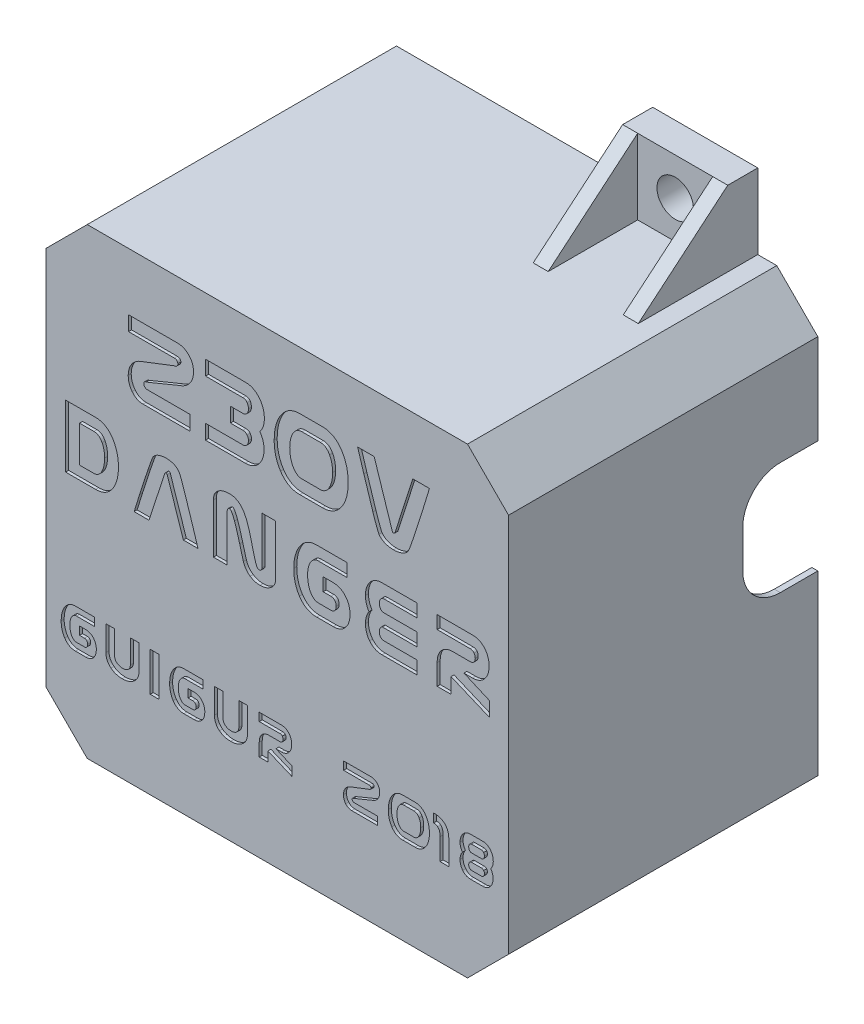
from build123d import *

# Parameters (mm, degrees)
BOSS_EXTRU_1_DEPTH                  = 40
BOSS_EXTRU_2_DEPTH                  = 1.2
ENL_V_MAT_EXTRU_1_DEPTH             = 0.8
ENL_V_MAT_EXTRU_2_DEPTH             = 0.8
ESQUISSE5_W                         = 1.153724199
ESQUISSE5_H                         = 5.191758898
ENL_V_MAT_EXTRU_3_DEPTH             = 0.4
ESQUISSE7_W                         = 10
ESQUISSE7_H                         = 10
ESQUISSE7_R                         = 2.43160469
BOSS_EXTRU_3_DEPTH                  = 4
BOSS_EXTRU_4_DEPTH                  = 2
R_P_TITION_CIRCULAIRE1_COUNT        = 2
R_P_TITION_CIRCULAIRE1_COPY_1_DEPTH = 2


with BuildPart() as part:
    # Esquisse1 → Boss.-Extru.1 (new body)
    with BuildSketch(Plane.XY):
        Polygon((0, -56.13137085), (5.46862915, -61.6), (56.13137085, -61.6), (61.6, -56.13137085), (61.6, -5.46862915), (56.13137085, 0), (5.46862915, 0), (0, -5.46862915), align=None)
        Polygon((0.8, -55.8), (0.8, -5.8), (5.8, -0.8), (55.8, -0.8), (60.8, -5.8), (60.8, -55.8), (55.8, -60.8), (5.8, -60.8), align=None, mode=Mode.SUBTRACT)
    extrude(amount=BOSS_EXTRU_1_DEPTH)

    # Esquisse2 → Boss.-Extru.2 (add)
    with BuildSketch(Plane.XY.offset(40)):
        Polygon((61.6, -5.46862915), (56.13137085, 0), (5.46862915, 0), (0, -5.46862915), (0, -56.13137085), (5.46862915, -61.6), (56.13137085, -61.6), (61.6, -56.13137085), align=None)
    extrude(amount=BOSS_EXTRU_2_DEPTH)

    # Esquisse3 → Enlèv. mat.-Extru.1 (cut)
    with BuildSketch(Plane(origin=(61.6, 0, 0), x_dir=(0, 0, -1), z_dir=(1, 0, 0))):
        with BuildLine():
            Line((0, -32.5), (-5, -32.5))
            ThreePointArc((-5, -32.5), (-8.535533906, -31.035533906), (-10, -27.5))
            Line((-10, -27.5), (-10, -22.5))
            ThreePointArc((-10, -22.5), (-8.535533906, -18.964466094), (-5, -17.5))
            Line((-5, -17.5), (0, -17.5))
            Line((0, -17.5), (0, -32.5))
        make_face()
    extrude(amount=-ENL_V_MAT_EXTRU_1_DEPTH, mode=Mode.SUBTRACT)

    # Esquisse4 → Enlèv. mat.-Extru.2 (cut)
    with BuildSketch(Plane.XZ.offset(61.6)):
        with BuildLine():
            Line((23.3, 0), (38.3, 0))
            Line((38.3, 0), (38.3, 20))
            ThreePointArc((38.3, 20), (36.835533906, 23.535533906), (33.3, 25))
            Line((33.3, 25), (28.3, 25))
            ThreePointArc((28.3, 25), (24.764466094, 23.535533906), (23.3, 20))
            Line((23.3, 20), (23.3, 0))
        make_face()
    extrude(amount=-ENL_V_MAT_EXTRU_2_DEPTH, mode=Mode.SUBTRACT)

    # Esquisse5 → Enlèv. mat.-Extru.3 (cut)
    # profile 1 of 20: a face of its own
    with BuildSketch(Plane.XY.offset(41.2)):
        with BuildLine():
            Line((17.842099883, -12.388257917), (13.325675248, -14.247962178))
            add(Edge.make_bspline(
                [(13.325675248, -14.247962178), (13.30122285, -14.249039085), (13.254269683, -14.251106947), (13.18826449, -14.269300867), (13.131370896, -14.300802962), (13.06984923, -14.357448424), (13.015916953, -14.452480119), (13.008857721, -14.537212215), (13.005246379, -14.580559232)],
                knots=[0, 0, 0, 0, 0.846382646, 1.625212577, 2.348874433, 3.0785795, 4.505467584, 6, 6, 6, 6], degree=3))
            add(Edge.make_bspline(
                [(13.005246379, -14.580559232), (13.006801753, -14.609803279), (13.009930331, -14.668626581), (13.035526821, -14.753630944), (13.074601032, -14.835349906), (13.130925265, -14.909397596), (13.201847121, -14.972084279), (13.283882732, -15.020602831), (13.378898877, -15.046906851), (13.445177962, -15.050968433), (13.47980559, -15.053090413)],
                knots=[0, 0, 0, 0, 0.939765321, 1.890302661, 2.834341378, 3.844063826, 4.861495082, 5.865573951, 6.88486523, 8, 8, 8, 8], degree=3))
            Line((13.47980559, -15.053090413), (19.142067638, -15.053090413))
            Line((19.142067638, -15.053090413), (19.142067638, -17))
            Line((19.142067638, -17), (12.899788776, -17))
            add(Edge.make_bspline(
                [(12.899788776, -17), (12.828039, -16.997315479), (12.686514415, -16.992020332), (12.479007968, -16.960543731), (12.283060612, -16.902036552), (12.095562229, -16.825270765), (11.919784742, -16.722379897), (11.751246762, -16.600924502), (11.597032506, -16.452698379), (11.503544266, -16.342417178), (11.455830833, -16.286133152)],
                knots=[0, 0, 0, 0, 1.031026725, 2.033673669, 3.004785919, 3.962452291, 4.936909119, 5.923627981, 6.940285576, 8, 8, 8, 8], degree=3))
            add(Edge.make_bspline(
                [(11.455830833, -16.286133152), (11.413520132, -16.230095811), (11.328991094, -16.118143456), (11.221770515, -15.937264333), (11.133101823, -15.747001899), (11.056452267, -15.550529685), (11.001188036, -15.344092995), (10.957272069, -15.131042462), (10.933145607, -14.908305756), (10.930097119, -14.757051251), (10.92854282, -14.679932743)],
                knots=[0, 0, 0, 0, 0.977383681, 1.95263378, 2.921271938, 3.898700964, 4.885471499, 5.893614434, 6.926039844, 8, 8, 8, 8], degree=3))
            add(Edge.make_bspline(
                [(10.92854282, -14.679932743), (10.929504355, -14.610925946), (10.931394115, -14.475303031), (10.952568659, -14.274676191), (10.986799606, -14.079410024), (11.035577188, -13.889792651), (11.096221238, -13.705701225), (11.172232138, -13.528370031), (11.260834724, -13.356039005), (11.329951731, -13.246314415), (11.364569446, -13.191358121)],
                knots=[0, 0, 0, 0, 1.051694632, 2.066954261, 3.071749998, 4.071618028, 5.049357116, 6.023722616, 7.010168273, 8, 8, 8, 8], degree=3))
            add(Edge.make_bspline(
                [(11.364569446, -13.191358121), (11.406037817, -13.131689538), (11.488544637, -13.012970985), (11.631923042, -12.850519563), (11.789059187, -12.701626347), (11.95996039, -12.566147112), (12.14282372, -12.44127642), (12.34053837, -12.33179923), (12.551865296, -12.23643939), (12.699295882, -12.183769022), (12.774050865, -12.157062403)],
                knots=[0, 0, 0, 0, 0.978134692, 1.946128585, 2.912321876, 3.890753236, 4.880810932, 5.891754375, 6.931009707, 8, 8, 8, 8], degree=3))
            Line((12.774050865, -12.157062403), (17.069420141, -10.498133193))
            add(Edge.make_bspline(
                [(17.069420141, -10.498133193), (17.104875854, -10.496574193), (17.173386919, -10.493561737), (17.270710162, -10.458571311), (17.357093417, -10.402775313), (17.430134473, -10.327770027), (17.489257925, -10.24537155), (17.531167147, -10.162851349), (17.551734474, -10.081996336), (17.549246062, -10.030416176), (17.548035414, -10.005321704)],
                knots=[0, 0, 0, 0, 1.110062636, 2.144973771, 3.205952938, 4.317844512, 5.414607604, 6.383960155, 7.213773928, 8, 8, 8, 8], degree=3))
            add(Edge.make_bspline(
                [(17.548035414, -10.005321704), (17.537979446, -9.970594127), (17.519079149, -9.905323284), (17.48088476, -9.816611813), (17.434763279, -9.744726044), (17.380179386, -9.689163731), (17.316445229, -9.649901477), (17.243991061, -9.620618378), (17.159940158, -9.605458761), (17.100567479, -9.603021943), (17.069420141, -9.601743571)],
                knots=[0, 0, 0, 0, 1.256967871, 2.362484281, 3.34736549, 4.212049449, 5.047126598, 5.933600789, 6.915951972, 8, 8, 8, 8], degree=3))
            Line((17.069420141, -9.601743571), (10.963019343, -9.601743571))
            Line((10.963019343, -9.601743571), (10.963019343, -7.654833984))
            Line((10.963019343, -7.654833984), (17.41418538, -7.654833984))
            add(Edge.make_bspline(
                [(17.41418538, -7.654833984), (17.497461691, -7.656383338), (17.661387325, -7.659433171), (17.899767915, -7.695136478), (18.125655533, -7.7505581), (18.339914792, -7.823946709), (18.540242308, -7.925789163), (18.728572085, -8.046466407), (18.903833865, -8.190592778), (19.007996853, -8.300608138), (19.060946405, -8.356532648)],
                knots=[0, 0, 0, 0, 1.080886292, 2.127675522, 3.122193802, 4.099705838, 5.061755408, 6.033532562, 7.000378421, 8, 8, 8, 8], degree=3))
            add(Edge.make_bspline(
                [(19.060946405, -8.356532648), (19.105785838, -8.410578459), (19.194811423, -8.51788267), (19.311811524, -8.69057286), (19.406091901, -8.875724542), (19.488886582, -9.067139554), (19.548745081, -9.270398401), (19.593896598, -9.481788065), (19.620622809, -9.703133309), (19.623353446, -9.853824026), (19.624738973, -9.930284564)],
                knots=[0, 0, 0, 0, 0.985114851, 1.955877242, 2.918962928, 3.89669785, 4.877923382, 5.886237574, 6.927475987, 8, 8, 8, 8], degree=3))
            add(Edge.make_bspline(
                [(19.624738973, -9.930284564), (19.620322875, -10.061958972), (19.611625194, -10.321296994), (19.522896622, -10.698378219), (19.389689767, -11.059910882), (19.254812816, -11.278184989), (19.186684316, -11.388438723)],
                knots=[0, 0, 0, 0, 1.02119723, 2.011288858, 2.995470272, 4, 4, 4, 4], degree=3))
            add(Edge.make_bspline(
                [(19.186684316, -11.388438723), (19.145732738, -11.445968998), (19.064191859, -11.560520607), (18.925676974, -11.717977319), (18.776517793, -11.863912482), (18.614273547, -11.995611867), (18.438663628, -12.113494447), (18.251377754, -12.218853922), (18.052685596, -12.313431425), (17.912892773, -12.363103392), (17.842099883, -12.388257917)],
                knots=[0, 0, 0, 0, 0.992502944, 1.97622574, 2.944298351, 3.924201208, 4.91030968, 5.914939945, 6.94409867, 8, 8, 8, 8], degree=3))
        make_face()
    # profile 2 of 20: a face of its own
    with BuildSketch(Plane.XY.offset(41.2)):
        with BuildLine():
            add(Edge.make_bspline(
                [(28.462086071, -12.392313978), (28.505811642, -12.451710578), (28.594451023, -12.572117874), (28.707910209, -12.769590467), (28.803185672, -12.984023057), (28.880716353, -13.211816943), (28.943807821, -13.447545429), (28.987577322, -13.68837222), (29.018253128, -13.931474297), (29.020631934, -14.095088636), (29.021822578, -14.176981099)],
                knots=[0, 0, 0, 0, 0.929418667, 1.884094209, 2.864635821, 3.883547588, 4.915213964, 5.938323926, 6.968087181, 8, 8, 8, 8], degree=3))
            add(Edge.make_bspline(
                [(29.021822578, -14.176981099), (29.019672234, -14.269646025), (29.015439791, -14.452034971), (28.988029418, -14.721029273), (28.935263561, -14.978570839), (28.870408604, -15.227998875), (28.780083611, -15.464937739), (28.671559882, -15.692085079), (28.545202413, -15.909999609), (28.443883932, -16.044400471), (28.393133024, -16.111722501)],
                knots=[0, 0, 0, 0, 1.072653062, 2.111263344, 3.124028896, 4.112907344, 5.090954239, 6.053384189, 7.024930901, 8, 8, 8, 8], degree=3))
            add(Edge.make_bspline(
                [(28.393133024, -16.111722501), (28.33462493, -16.182875921), (28.219534939, -16.322840259), (28.020483513, -16.504029832), (27.806730025, -16.657258101), (27.577444476, -16.781631951), (27.333908692, -16.879669988), (27.075012583, -16.951516264), (26.799676455, -16.991532097), (26.611294101, -16.99713914), (26.515176485, -17)],
                knots=[0, 0, 0, 0, 1.024425824, 2.015125657, 2.986194293, 3.945970196, 4.911628937, 5.903014533, 6.930063025, 8, 8, 8, 8], degree=3))
            Line((26.515176485, -17), (21.234184231, -17))
            Line((21.234184231, -17), (21.234184231, -15.053090413))
            Line((21.234184231, -15.053090413), (26.215027924, -15.053090413))
            add(Edge.make_bspline(
                [(26.215027924, -15.053090413), (26.269006732, -15.05064243), (26.374385746, -15.045863405), (26.521117713, -14.988511274), (26.655414483, -14.904824567), (26.723366453, -14.82345389), (26.758540183, -14.781334284)],
                knots=[0, 0, 0, 0, 1.021795646, 1.994779421, 2.962044985, 4, 4, 4, 4], degree=3))
            add(Edge.make_bspline(
                [(26.758540183, -14.781334284), (26.787111275, -14.739620538), (26.844337984, -14.65606964), (26.903359912, -14.512970801), (26.93824862, -14.356458134), (26.942778844, -14.247474778), (26.945119019, -14.191177315)],
                knots=[0, 0, 0, 0, 0.961154893, 1.925153318, 2.928197758, 4, 4, 4, 4], degree=3))
            add(Edge.make_bspline(
                [(26.945119019, -14.191177315), (26.942528881, -14.136949089), (26.937494369, -14.031544377), (26.905891001, -13.880116772), (26.848287268, -13.742423134), (26.792494721, -13.663002325), (26.764624276, -13.623328686)],
                knots=[0, 0, 0, 0, 1.072559753, 2.084760305, 3.043266752, 4, 4, 4, 4], degree=3))
            add(Edge.make_bspline(
                [(26.764624276, -13.623328686), (26.729280415, -13.583377502), (26.660572828, -13.505713394), (26.525396144, -13.424306964), (26.373345546, -13.374264612), (26.264782412, -13.36865436), (26.208943831, -13.365768772)],
                knots=[0, 0, 0, 0, 1.003829192, 1.951419017, 2.946328742, 4, 4, 4, 4], degree=3))
            Line((26.208943831, -13.365768772), (24.545958559, -13.365768772))
            Line((24.545958559, -13.365768772), (24.545958559, -11.418859185))
            Line((24.545958559, -11.418859185), (26.208943831, -11.418859185))
            add(Edge.make_bspline(
                [(26.208943831, -11.418859185), (26.264734879, -11.415171213), (26.373352322, -11.407991241), (26.527548855, -11.357215297), (26.660178536, -11.265696132), (26.72916664, -11.184684389), (26.764624276, -11.143046994)],
                knots=[0, 0, 0, 0, 1.039153806, 2.023088513, 2.983931946, 4, 4, 4, 4], degree=3))
            add(Edge.make_bspline(
                [(26.764624276, -11.143046994), (26.792583762, -11.099963027), (26.849037732, -11.012970695), (26.905439092, -10.864169132), (26.937836323, -10.700997571), (26.942628601, -10.587523216), (26.945119019, -10.528553655)],
                knots=[0, 0, 0, 0, 0.944972859, 1.908027508, 2.912858352, 4, 4, 4, 4], degree=3))
            add(Edge.make_bspline(
                [(26.945119019, -10.528553655), (26.9438115, -10.468146126), (26.94128998, -10.351651614), (26.903753594, -10.185100906), (26.851847807, -10.029712042), (26.794892066, -9.938837411), (26.766652306, -9.893780009)],
                knots=[0, 0, 0, 0, 1.080465717, 2.08365295, 3.049838007, 4, 4, 4, 4], degree=3))
            add(Edge.make_bspline(
                [(26.766652306, -9.893780009), (26.732218724, -9.849158617), (26.665656777, -9.762903093), (26.532314092, -9.668636588), (26.379708045, -9.61121988), (26.270974609, -9.604962952), (26.215027924, -9.601743571)],
                knots=[0, 0, 0, 0, 1.034862529, 2.000444302, 2.971167311, 4, 4, 4, 4], degree=3))
            Line((26.215027924, -9.601743571), (21.234184231, -9.601743571))
            Line((21.234184231, -9.601743571), (21.234184231, -7.654833984))
            Line((21.234184231, -7.654833984), (26.525316639, -7.654833984))
            add(Edge.make_bspline(
                [(26.525316639, -7.654833984), (26.620814127, -7.657308305), (26.808837571, -7.662179953), (27.08306739, -7.708091282), (27.343493999, -7.781685308), (27.590333643, -7.882414952), (27.821210412, -8.016174884), (28.037149634, -8.178552345), (28.242603482, -8.366551369), (28.36113106, -8.513070821), (28.421525455, -8.587728161)],
                knots=[0, 0, 0, 0, 1.04391541, 2.055348009, 3.031456415, 3.999577629, 4.963538636, 5.941102417, 6.950911875, 8, 8, 8, 8], degree=3))
            add(Edge.make_bspline(
                [(28.421525455, -8.587728161), (28.472691457, -8.658610923), (28.574768711, -8.800023528), (28.707101452, -9.025426886), (28.815974196, -9.262615179), (28.908850294, -9.507958291), (28.976775627, -9.765868475), (29.027521364, -10.032781968), (29.058882781, -10.310811352), (29.062545372, -10.499403274), (29.064411225, -10.595478672)],
                knots=[0, 0, 0, 0, 0.976837258, 1.948810956, 2.915660441, 3.891152394, 4.877297507, 5.892457689, 6.926343379, 8, 8, 8, 8], degree=3))
            add(Edge.make_bspline(
                [(29.064411225, -10.595478672), (29.062269239, -10.680046529), (29.058007624, -10.848299535), (29.029794495, -11.097440403), (28.979945242, -11.340543432), (28.914321875, -11.576288312), (28.829346026, -11.801904712), (28.725485603, -12.013753728), (28.604101641, -12.211694227), (28.509249504, -12.332330081), (28.462086071, -12.392313978)],
                knots=[0, 0, 0, 0, 1.049909494, 2.088860178, 3.107684334, 4.127924748, 5.123956349, 6.096081997, 7.053312763, 8, 8, 8, 8], degree=3))
        make_face()
    # profile 3 of 20: a face of its own
    with BuildSketch(Plane.XY.offset(41.2)):
        with BuildLine():
            Line((36.816761835, -17), (33.790939852, -17))
            add(Edge.make_bspline(
                [(33.790939852, -17), (33.658138363, -16.995942514), (33.398209975, -16.988000916), (33.019975393, -16.91901619), (32.662624388, -16.807886926), (32.328324838, -16.646975822), (32.013242363, -16.446036464), (31.722922969, -16.196203205), (31.453775507, -15.902981765), (31.297453538, -15.681616933), (31.217368743, -15.568210242)],
                knots=[0, 0, 0, 0, 1.034218592, 2.024245151, 2.985640523, 3.94239106, 4.906899337, 5.889765103, 6.918912482, 8, 8, 8, 8], degree=3))
            add(Edge.make_bspline(
                [(31.217368743, -15.568210242), (31.14907121, -15.45917859), (31.012359183, -15.240928568), (30.842920603, -14.889965804), (30.696014266, -14.522356195), (30.576556714, -14.135102763), (30.486202825, -13.728607619), (30.418539061, -13.304795401), (30.380638435, -12.861479594), (30.374702816, -12.560032727), (30.371679891, -12.406510194)],
                knots=[0, 0, 0, 0, 0.929490259, 1.860572287, 2.812556742, 3.7895154, 4.786606681, 5.820667601, 6.890097506, 8, 8, 8, 8], degree=3))
            add(Edge.make_bspline(
                [(30.371679891, -12.406510194), (30.374484052, -12.249589167), (30.380005213, -11.940624659), (30.421187257, -11.486754878), (30.488066805, -11.050520137), (30.580366318, -10.631911465), (30.702560991, -10.231452418), (30.851018656, -9.849198249), (31.024271539, -9.483985519), (31.162684447, -9.255223087), (31.231564958, -9.141380575)],
                knots=[0, 0, 0, 0, 1.100337574, 2.166473559, 3.192969705, 4.193600732, 5.169869462, 6.125947774, 7.067387018, 8, 8, 8, 8], degree=3))
            add(Edge.make_bspline(
                [(31.231564958, -9.141380575), (31.312089444, -9.023105255), (31.468671608, -8.793115513), (31.741069206, -8.490126778), (32.030331123, -8.230120022), (32.343163562, -8.019770521), (32.676634137, -7.855255467), (33.030604462, -7.740706617), (33.403809196, -7.665648106), (33.66009625, -7.658488974), (33.790939852, -7.654833984)],
                knots=[0, 0, 0, 0, 1.107213981, 2.153009253, 3.147056547, 4.11281617, 5.063568818, 6.017330252, 6.987776991, 8, 8, 8, 8], degree=3))
            Line((33.790939852, -7.654833984), (36.816761835, -7.654833984))
            add(Edge.make_bspline(
                [(36.816761835, -7.654833984), (36.947587427, -7.658567758), (37.204503845, -7.665900176), (37.577969335, -7.740012233), (37.931548078, -7.855792938), (38.264667341, -8.019591026), (38.577360459, -8.230879778), (38.86871198, -8.488718468), (39.138793161, -8.793946939), (39.295445664, -9.023261553), (39.376136729, -9.141380575)],
                knots=[0, 0, 0, 0, 1.012145351, 1.987659708, 2.936376568, 3.887056274, 4.852741804, 5.850635197, 6.892870965, 8, 8, 8, 8], degree=3))
            add(Edge.make_bspline(
                [(39.376136729, -9.141380575), (39.444778683, -9.255332985), (39.582864034, -9.484568282), (39.759744867, -9.848169414), (39.904334063, -10.232025612), (40.027789983, -10.63178689), (40.118713713, -11.050773488), (40.189985218, -11.48640764), (40.226783988, -11.940778083), (40.232909897, -12.249621099), (40.236021796, -12.406510194)],
                knots=[0, 0, 0, 0, 0.932533836, 1.875955677, 2.830247256, 3.806433135, 4.806979245, 5.8341214, 6.899755806, 8, 8, 8, 8], degree=3))
            add(Edge.make_bspline(
                [(40.236021796, -12.406510194), (40.23417834, -12.560744745), (40.230565492, -12.863017234), (40.187688803, -13.306500731), (40.124014337, -13.731433432), (40.033831384, -14.138041209), (39.912723028, -14.524425234), (39.769436446, -14.892503505), (39.599501269, -15.241972466), (39.463909505, -15.459789257), (39.396417037, -15.568210242)],
                knots=[0, 0, 0, 0, 1.115201667, 2.185598378, 3.219421606, 4.221777843, 5.194551088, 6.145211973, 7.076756464, 8, 8, 8, 8], degree=3))
            add(Edge.make_bspline(
                [(39.396417037, -15.568210242), (39.316297675, -15.681573415), (39.159908232, -15.902853302), (38.890892193, -16.197060825), (38.598829336, -16.444628246), (38.284853702, -16.648229277), (37.948956229, -16.807707625), (37.589757258, -16.919069527), (37.210135385, -16.987859657), (36.949555775, -16.995901697), (36.816761835, -17)],
                knots=[0, 0, 0, 0, 1.079123464, 2.106401151, 3.091489894, 4.049826571, 5.0095906, 5.974254899, 6.967660313, 8, 8, 8, 8], degree=3))
        make_face()
        with BuildLine():
            add(Edge.make_bspline(
                [(36.518641304, -15.053090413), (36.580363643, -15.050232218), (36.702456067, -15.044578446), (36.88098383, -15.003332623), (37.049250018, -14.932523078), (37.209354773, -14.836658791), (37.357803471, -14.710872657), (37.496603508, -14.558384822), (37.626796282, -14.379611426), (37.701048334, -14.246132238), (37.739515858, -14.176981099)],
                knots=[0, 0, 0, 0, 0.933952744, 1.847443833, 2.755819538, 3.687695769, 4.661175002, 5.689577418, 6.803046732, 8, 8, 8, 8], degree=3))
            add(Edge.make_bspline(
                [(37.739515858, -14.176981099), (37.773793165, -14.109909147), (37.843165858, -13.97416447), (37.926648705, -13.759062781), (37.998373956, -13.534159007), (38.056178513, -13.299577526), (38.104041385, -13.054757067), (38.134954475, -12.799211716), (38.156595236, -12.533297343), (38.158400104, -12.352475627), (38.159318237, -12.260491975)],
                knots=[0, 0, 0, 0, 0.911858577, 1.845480002, 2.790699654, 3.769787348, 4.770281357, 5.810305067, 6.886106478, 8, 8, 8, 8], degree=3))
            add(Edge.make_bspline(
                [(38.159318237, -12.260491975), (38.158140373, -12.171908565), (38.155827014, -11.997928105), (38.13791226, -11.741880399), (38.105044903, -11.4962248), (38.061048571, -11.261115938), (38.003938338, -11.036960501), (37.935333354, -10.823156348), (37.852908295, -10.620201358), (37.786467523, -10.492257), (37.753712073, -10.429180145)],
                knots=[0, 0, 0, 0, 1.121718679, 2.203088952, 3.247925157, 4.258643601, 5.230325611, 6.175126462, 7.100333262, 8, 8, 8, 8], degree=3))
            add(Edge.make_bspline(
                [(37.753712073, -10.429180145), (37.71592627, -10.363370818), (37.643035929, -10.236421966), (37.514220376, -10.066991382), (37.375982175, -9.923093304), (37.225831681, -9.805552484), (37.064843438, -9.713234475), (36.892412905, -9.647943011), (36.709099319, -9.607789931), (36.583071258, -9.603788991), (36.518641304, -9.601743571)],
                knots=[0, 0, 0, 0, 1.159924162, 2.237540565, 3.246791053, 4.204607513, 5.144843728, 6.074441246, 7.015587001, 8, 8, 8, 8], degree=3))
            Line((36.518641304, -9.601743571), (34.08297629, -9.601743571))
            add(Edge.make_bspline(
                [(34.08297629, -9.601743571), (34.019229433, -9.60384559), (33.893891806, -9.607978531), (33.711817233, -9.647644004), (33.540655344, -9.713133728), (33.381347174, -9.806771674), (33.229851171, -9.922359355), (33.091386839, -10.066488715), (32.964907342, -10.237095005), (32.891927361, -10.363480301), (32.853989614, -10.429180145)],
                knots=[0, 0, 0, 0, 0.977390634, 1.921723315, 2.844779187, 3.779196888, 4.748456517, 5.761124548, 6.836148081, 8, 8, 8, 8], degree=3))
            add(Edge.make_bspline(
                [(32.853989614, -10.429180145), (32.820990088, -10.492162336), (32.754172101, -10.619689718), (32.675542943, -10.824068162), (32.602894743, -11.036451684), (32.547119998, -11.261226192), (32.501723691, -11.496013196), (32.473274909, -11.742172469), (32.450953689, -11.997795842), (32.449250426, -12.171881095), (32.44838345, -12.260491975)],
                knots=[0, 0, 0, 0, 0.899777564, 1.821884511, 2.769474238, 3.741275945, 4.752118895, 5.795995979, 6.878143142, 8, 8, 8, 8], degree=3))
            add(Edge.make_bspline(
                [(32.44838345, -12.260491975), (32.449314939, -12.352473468), (32.451146062, -12.533290938), (32.472597167, -12.799235977), (32.504178757, -13.054547075), (32.549551241, -13.299480511), (32.60467971, -13.534498527), (32.677565492, -13.758603333), (32.758284385, -13.974131017), (32.826419981, -14.109914526), (32.860073706, -14.176981099)],
                knots=[0, 0, 0, 0, 1.115290582, 2.192441278, 3.2337694, 4.234007334, 5.212366875, 6.158772034, 7.090575497, 8, 8, 8, 8], degree=3))
            add(Edge.make_bspline(
                [(32.860073706, -14.176981099), (32.897734025, -14.24620783), (32.970578728, -14.380110056), (33.10105009, -14.558332106), (33.23973614, -14.710883055), (33.388210388, -14.836664702), (33.548317072, -14.932491605), (33.717162075, -15.003707104), (33.897176285, -15.044519716), (34.020587248, -15.050212493), (34.08297629, -15.053090413)],
                knots=[0, 0, 0, 0, 1.189586555, 2.300965076, 3.327436432, 4.299087736, 5.229214156, 6.135884178, 7.057616953, 8, 8, 8, 8], degree=3))
            Line((34.08297629, -15.053090413), (36.518641304, -15.053090413))
        make_face(mode=Mode.SUBTRACT)
    # profile 4 of 20: a face of its own
    with BuildSketch(Plane.XY.offset(41.2)):
        with BuildLine():
            add(Edge.make_bspline(
                [(51.058811067, -7.654833984), (51.035359203, -7.73601701), (50.98585047, -7.907400772), (50.903391291, -8.176330642), (50.817471079, -8.473206851), (50.720060798, -8.794981783), (50.611792063, -9.142001959), (50.496391125, -9.515220652), (50.372623979, -9.914724973), (50.287475867, -10.189870192), (50.243542678, -10.331834666)],
                knots=[0, 0, 0, 0, 0.724699688, 1.529898115, 2.412295502, 3.375202971, 4.413118663, 5.529890053, 6.725517159, 8, 8, 8, 8], degree=3))
            add(Edge.make_bspline(
                [(50.243542678, -10.331834666), (50.186731931, -10.512321272), (50.075035664, -10.867178082), (49.911014694, -11.389812471), (49.753169764, -11.893085632), (49.599344656, -12.375862579), (49.44814023, -12.837452913), (49.306897253, -13.280907498), (49.169284563, -13.704193242), (49.077579682, -13.979637171), (49.032808278, -14.114112144)],
                knots=[0, 0, 0, 0, 1.143477596, 2.248204568, 3.310283552, 4.330950144, 5.310225506, 6.245603386, 7.143482896, 8, 8, 8, 8], degree=3))
            add(Edge.make_bspline(
                [(49.032808278, -14.114112144), (48.981635247, -14.268310349), (48.885011237, -14.559464665), (48.74578503, -14.968714912), (48.619553662, -15.323908699), (48.510038148, -15.626075105), (48.418105912, -15.875693083), (48.339374328, -16.070585368), (48.276488062, -16.212241696), (48.234170643, -16.285668741), (48.217539889, -16.314525583)],
                knots=[0, 0, 0, 0, 1.660077683, 3.134529234, 4.416945922, 5.511654956, 6.418736683, 7.134478342, 7.659849831, 8, 8, 8, 8], degree=3))
            add(Edge.make_bspline(
                [(48.217539889, -16.314525583), (48.169406541, -16.377060053), (48.071528798, -16.504222052), (47.884553073, -16.667795652), (47.663508561, -16.807225741), (47.413197713, -16.922568246), (47.143183696, -17.014757211), (46.861438789, -17.081915512), (46.570512233, -17.120856147), (46.374174059, -17.126788138), (46.274686364, -17.129793972)],
                knots=[0, 0, 0, 0, 0.86552043, 1.760010266, 2.712025938, 3.72892115, 4.781335431, 5.842573722, 6.906797582, 8, 8, 8, 8], degree=3))
            add(Edge.make_bspline(
                [(46.274686364, -17.129793972), (46.175144006, -17.127926009), (45.977906781, -17.124224752), (45.688579569, -17.080549904), (45.407914839, -17.019750188), (45.142893126, -16.928722123), (44.896822782, -16.815327045), (44.679841947, -16.673998937), (44.490688156, -16.510120945), (44.392577712, -16.379298646), (44.344001024, -16.314525583)],
                knots=[0, 0, 0, 0, 1.096933979, 2.173509026, 3.220794879, 4.260596123, 5.257852598, 6.200872736, 7.109211625, 8, 8, 8, 8], degree=3))
            add(Edge.make_bspline(
                [(44.344001024, -16.314525583), (44.326482443, -16.287144921), (44.281216547, -16.216396599), (44.221121341, -16.074803151), (44.141245254, -15.881646501), (44.047407959, -15.634203697), (43.934126327, -15.333823461), (43.813079229, -14.97677632), (43.672086111, -14.566812084), (43.574473083, -14.275081392), (43.522648542, -14.120196237)],
                knots=[0, 0, 0, 0, 0.332113521, 0.858141187, 1.56837409, 2.472577314, 3.564543861, 4.85280192, 6.329095027, 8, 8, 8, 8], degree=3))
            add(Edge.make_bspline(
                [(43.522648542, -14.120196237), (43.481909951, -13.996544241), (43.397153654, -13.739287305), (43.269028942, -13.338326868), (43.126965264, -12.91018705), (42.982482241, -12.451812132), (42.827357541, -11.964724239), (42.666824871, -11.448175599), (42.49236899, -10.904389075), (42.377133444, -10.531368869), (42.317998235, -10.339946789)],
                knots=[0, 0, 0, 0, 0.787514981, 1.638418286, 2.546197898, 3.51611837, 4.545552766, 5.638404855, 6.788104646, 8, 8, 8, 8], degree=3))
            add(Edge.make_bspline(
                [(42.317998235, -10.339946789), (42.179013083, -9.893228201), (41.900777217, -8.998937476), (41.627387158, -8.103153473), (41.490561661, -7.654833984)],
                knots=[0, 0, 0, 0, 0.999045558, 2, 2, 2, 2], degree=3))
            Line((41.490561661, -7.654833984), (43.695031162, -7.654833984))
            Line((43.695031162, -7.654833984), (46.110415868, -15.063230568))
            add(Edge.make_bspline(
                [(46.110415868, -15.063230568), (46.11501637, -15.081512352), (46.123643777, -15.115796518), (46.159920987, -15.155899693), (46.210188067, -15.17899796), (46.248051125, -15.181517073), (46.268602272, -15.182884386)],
                knots=[0, 0, 0, 0, 1.025122814, 1.922431674, 2.872346438, 4, 4, 4, 4], degree=3))
            add(Edge.make_bspline(
                [(46.268602272, -15.182884386), (46.29048808, -15.18139455), (46.332159768, -15.178557826), (46.389089182, -15.155088572), (46.437196812, -15.117540753), (46.455726085, -15.081759492), (46.465321261, -15.063230568)],
                knots=[0, 0, 0, 0, 1.071771977, 2.040708197, 2.985402743, 4, 4, 4, 4], degree=3))
            Line((46.465321261, -15.063230568), (48.834061258, -7.654833984))
            Line((48.834061258, -7.654833984), (51.058811067, -7.654833984))
        make_face()
    # profile 5 of 20: a face of its own
    with BuildSketch(Plane.XY.offset(41.2)):
        with BuildLine():
            Line((6.60243761, -30), (2.591443323, -30))
            Line((2.591443323, -30), (2.591443323, -21.693185764))
            Line((2.591443323, -21.693185764), (6.60243761, -21.693185764))
            add(Edge.make_bspline(
                [(6.60243761, -21.693185764), (6.718134048, -21.696484612), (6.945327752, -21.702962577), (7.275983626, -21.769230295), (7.589326764, -21.871424332), (7.884143683, -22.01743417), (8.160428319, -22.205773858), (8.419153097, -22.434406091), (8.65931963, -22.705265694), (8.797396146, -22.909500265), (8.868424046, -23.014560511)],
                knots=[0, 0, 0, 0, 1.009750817, 1.982853009, 2.934238853, 3.882882464, 4.84693367, 5.847634392, 6.892802235, 8, 8, 8, 8], degree=3))
            add(Edge.make_bspline(
                [(8.868424046, -23.014560511), (8.929604745, -23.115771696), (9.052545159, -23.319151931), (9.207162838, -23.643317733), (9.336316709, -23.983946129), (9.445667287, -24.339410829), (9.527305645, -24.711604582), (9.587577457, -25.099227638), (9.621126007, -25.502885947), (9.626454248, -25.777431576), (9.62916094, -25.91689795)],
                knots=[0, 0, 0, 0, 0.932859825, 1.87454825, 2.829173424, 3.805700552, 4.806596427, 5.833364266, 6.899371189, 8, 8, 8, 8], degree=3))
            add(Edge.make_bspline(
                [(9.62916094, -25.91689795), (9.627526983, -26.05399682), (9.624324716, -26.322686399), (9.586146311, -26.716872948), (9.529784058, -27.094666652), (9.448813964, -27.455652945), (9.344258692, -27.799907092), (9.215636734, -28.12611902), (9.067363683, -28.43778661), (8.946621495, -28.631008195), (8.886450987, -28.727297992)],
                knots=[0, 0, 0, 0, 1.115701538, 2.186578037, 3.220864659, 4.223670186, 5.19544001, 6.146527013, 7.076342635, 8, 8, 8, 8], degree=3))
            add(Edge.make_bspline(
                [(8.886450987, -28.727297992), (8.815958387, -28.828168089), (8.67816549, -29.025340313), (8.438847905, -29.28553916), (8.18102882, -29.506983358), (7.902280374, -29.686731102), (7.605331793, -29.829149365), (7.287753937, -29.928037402), (6.951526951, -29.989328021), (6.720482066, -29.996391274), (6.60243761, -30)],
                knots=[0, 0, 0, 0, 1.078982124, 2.109101837, 3.092896211, 4.053884185, 5.011538656, 5.97384235, 6.964804283, 8, 8, 8, 8], degree=3))
        make_face()
        with BuildLine():
            add(Edge.make_bspline(
                [(6.366284688, -28.269413701), (6.419950952, -28.266873475), (6.526109097, -28.261848611), (6.681256952, -28.225165991), (6.827197688, -28.16214776), (6.966030488, -28.076973186), (7.094183761, -27.96446118), (7.21600037, -27.830201606), (7.327577454, -27.670025538), (7.392519633, -27.551990393), (7.426268797, -27.490649866)],
                knots=[0, 0, 0, 0, 0.927016855, 1.833747709, 2.736366654, 3.664255449, 4.636241639, 5.672808025, 6.790604442, 8, 8, 8, 8], degree=3))
            add(Edge.make_bspline(
                [(7.426268797, -27.490649866), (7.454594965, -27.430868119), (7.511928787, -27.309866361), (7.58612439, -27.120590913), (7.64667228, -26.92142564), (7.698230381, -26.713447286), (7.734289985, -26.495031661), (7.76434797, -26.26792676), (7.780085773, -26.030692317), (7.782148736, -25.869446612), (7.783202221, -25.787103978)],
                knots=[0, 0, 0, 0, 0.90367025, 1.829081507, 2.774309556, 3.746013399, 4.754243876, 5.796980096, 6.87499353, 8, 8, 8, 8], degree=3))
            add(Edge.make_bspline(
                [(7.783202221, -25.787103978), (7.782195237, -25.707757894), (7.780217233, -25.551899565), (7.763768757, -25.32323824), (7.73683125, -25.104201565), (7.699503374, -24.895197733), (7.650318828, -24.69681266), (7.593274529, -24.50772858), (7.523038491, -24.328777696), (7.466742926, -24.215380586), (7.438887655, -24.15927124)],
                knots=[0, 0, 0, 0, 1.133507297, 2.22653146, 3.273263021, 4.285305599, 5.257682554, 6.191827152, 7.105308808, 8, 8, 8, 8], degree=3))
            add(Edge.make_bspline(
                [(7.438887655, -24.15927124), (7.405757172, -24.100893797), (7.34206064, -23.988657559), (7.231572922, -23.836881606), (7.110320236, -23.709506236), (6.979026532, -23.6055151), (6.83932917, -23.522873586), (6.689581175, -23.464868351), (6.530802811, -23.429266844), (6.42175478, -23.425624722), (6.366284688, -23.423772063)],
                knots=[0, 0, 0, 0, 1.17240029, 2.254052065, 3.271563844, 4.23588307, 5.172414958, 6.096739707, 7.031857605, 8, 8, 8, 8], degree=3))
            Line((6.366284688, -23.423772063), (4.437402042, -23.423772063))
            Line((4.437402042, -23.423772063), (4.437402042, -28.269413701))
            Line((4.437402042, -28.269413701), (6.366284688, -28.269413701))
        make_face(mode=Mode.SUBTRACT)
    # profile 6 of 20: a face of its own
    with BuildSketch(Plane.XY.offset(41.2)):
        with BuildLine():
            Line((20.225757173, -30), (18.27163681, -30))
            Line((18.27163681, -30), (16.119220101, -23.522920236))
            add(Edge.make_bspline(
                [(16.119220101, -23.522920236), (16.115032808, -23.507846442), (16.107031794, -23.479043671), (16.074533578, -23.44611073), (16.030727256, -23.424971782), (15.996924887, -23.424193665), (15.978609964, -23.423772063)],
                knots=[0, 0, 0, 0, 0.979985793, 1.87254153, 2.847292719, 4, 4, 4, 4], degree=3))
            add(Edge.make_bspline(
                [(15.978609964, -23.423772063), (15.95848055, -23.424149656), (15.921201333, -23.42484895), (15.871951614, -23.446975632), (15.831043406, -23.477915506), (15.815371682, -23.507688417), (15.807354028, -23.522920236)],
                knots=[0, 0, 0, 0, 1.135889228, 2.103640992, 3.029822789, 4, 4, 4, 4], degree=3))
            Line((15.807354028, -23.522920236), (13.696399282, -30))
            Line((13.696399282, -30), (11.718843896, -30))
            add(Edge.make_bspline(
                [(11.718843896, -30), (11.739199629, -29.930874596), (11.782431042, -29.784066372), (11.852499542, -29.552040632), (11.932561661, -29.295870732), (12.018998226, -29.014621134), (12.112072567, -28.708374079), (12.21530062, -28.378023389), (12.327082367, -28.023687327), (12.403895821, -27.779089824), (12.443526909, -27.652892332)],
                knots=[0, 0, 0, 0, 0.7040366, 1.49522977, 2.367993784, 3.326219461, 4.369909937, 5.495184363, 6.707666881, 8, 8, 8, 8], degree=3))
            add(Edge.make_bspline(
                [(12.443526909, -27.652892332), (12.535252998, -27.366796519), (12.716672072, -26.800946196), (12.989606603, -25.962326865), (13.256744895, -25.142615189), (13.437625262, -24.603807368), (13.52694604, -24.337737952)],
                knots=[0, 0, 0, 0, 1.03370395, 2.044495896, 3.034349887, 4, 4, 4, 4], degree=3))
            add(Edge.make_bspline(
                [(13.52694604, -24.337737952), (13.573171434, -24.201920518), (13.660358158, -23.945752294), (13.78378264, -23.585261375), (13.895832271, -23.273082792), (13.993782024, -23.00853594), (14.073329299, -22.789928077), (14.141751033, -22.61975697), (14.196260437, -22.496868073), (14.230952101, -22.432167334), (14.244418277, -22.407052612)],
                knots=[0, 0, 0, 0, 1.670598651, 3.150952515, 4.436832603, 5.532604503, 6.435903109, 7.145337453, 7.668247805, 8, 8, 8, 8], degree=3))
            add(Edge.make_bspline(
                [(14.244418277, -22.407052612), (14.288976706, -22.350783776), (14.37858008, -22.237631728), (14.547302271, -22.094072768), (14.741038213, -21.971327601), (14.960298645, -21.87202874), (15.19631042, -21.791345501), (15.446406846, -21.734011562), (15.706592596, -21.69881334), (15.88355608, -21.695078003), (15.973201882, -21.693185764)],
                knots=[0, 0, 0, 0, 0.886854184, 1.783391553, 2.72659125, 3.718528995, 4.756066533, 5.809985515, 6.890586929, 8, 8, 8, 8], degree=3))
            add(Edge.make_bspline(
                [(15.973201882, -21.693185764), (16.062255021, -21.695030384), (16.237441742, -21.69865915), (16.495723245, -21.734432498), (16.744734056, -21.791218187), (16.981052414, -21.87255185), (17.201043297, -21.970413173), (17.393491155, -22.093733215), (17.558961293, -22.237312985), (17.644904183, -22.350747001), (17.687563934, -22.407052612)],
                knots=[0, 0, 0, 0, 1.108509967, 2.180678047, 3.240842741, 4.284528911, 5.289141658, 6.231623262, 7.122225097, 8, 8, 8, 8], degree=3))
            add(Edge.make_bspline(
                [(17.687563934, -22.407052612), (17.703084759, -22.431415407), (17.742603811, -22.49344784), (17.797349393, -22.617090727), (17.869626585, -22.785548856), (17.953889309, -23.002814417), (18.050167828, -23.26781977), (18.162677369, -23.579831463), (18.286322077, -23.940048074), (18.372168816, -24.19646592), (18.417655029, -24.33232987)],
                knots=[0, 0, 0, 0, 0.33590204, 0.855272191, 1.569850823, 2.471327993, 3.566765226, 4.852252584, 6.332154322, 8, 8, 8, 8], degree=3))
            add(Edge.make_bspline(
                [(18.417655029, -24.33232987), (18.453238316, -24.438044605), (18.52737535, -24.658299043), (18.640626247, -25.003520624), (18.763477424, -25.375793571), (18.892949552, -25.776894118), (19.031939943, -26.205081413), (19.17785377, -26.661199532), (19.331020968, -27.145133203), (19.436164433, -27.476833251), (19.490257996, -27.64748425)],
                knots=[0, 0, 0, 0, 0.768284934, 1.60070559, 2.502498723, 3.468447951, 4.50377384, 5.603269816, 6.766945007, 8, 8, 8, 8], degree=3))
            add(Edge.make_bspline(
                [(19.490257996, -27.64748425), (19.611923648, -28.039969655), (19.85519132, -28.824735195), (20.102256764, -29.608313385), (20.225757173, -30)],
                knots=[0, 0, 0, 0, 1.000261568, 2, 2, 2, 2], degree=3))
        make_face()
    # profile 7 of 20: a face of its own
    with BuildSketch(Plane.XY.offset(41.2)):
        with BuildLine():
            add(Edge.make_bspline(
                [(30.580792402, -28.327099911), (30.578497545, -28.392094428), (30.574012198, -28.519127602), (30.545104472, -28.705746225), (30.494202251, -28.882880084), (30.423667876, -29.05187782), (30.332031275, -29.211632226), (30.222422264, -29.364169661), (30.088985704, -29.504925921), (29.989680359, -29.590439862), (29.939033316, -29.634053105)],
                knots=[0, 0, 0, 0, 1.033557896, 2.02011103, 2.993996416, 3.95760876, 4.924720518, 5.916672889, 6.937475535, 8, 8, 8, 8], degree=3))
            add(Edge.make_bspline(
                [(29.939033316, -29.634053105), (29.888086147, -29.672975273), (29.786980159, -29.75021733), (29.622968813, -29.846850054), (29.453126823, -29.931353023), (29.274319782, -29.996805838), (29.08889269, -30.050150956), (28.896405913, -30.087000292), (28.696430286, -30.112001866), (28.560652647, -30.114234717), (28.491469985, -30.11537242)],
                knots=[0, 0, 0, 0, 0.988446452, 1.961597804, 2.931918164, 3.911848073, 4.895062306, 5.906081391, 6.93308746, 8, 8, 8, 8], degree=3))
            add(Edge.make_bspline(
                [(28.491469985, -30.11537242), (28.431335777, -30.11446741), (28.311990673, -30.112671287), (28.136005434, -30.094300317), (27.964823702, -30.063657445), (27.798920092, -30.019574816), (27.636730869, -29.966757129), (27.480472752, -29.898685067), (27.329063719, -29.819997882), (27.232760446, -29.758567224), (27.18451679, -29.727793197)],
                knots=[0, 0, 0, 0, 1.042592798, 2.069177457, 3.064664961, 4.055505099, 5.044150683, 6.019803576, 7.008009664, 8, 8, 8, 8], degree=3))
            add(Edge.make_bspline(
                [(27.18451679, -29.727793197), (27.131553789, -29.690230452), (27.026462983, -29.615697304), (26.881435812, -29.488462131), (26.749410137, -29.348513275), (26.627928277, -29.197125814), (26.52041541, -29.0320375), (26.422157765, -28.856765434), (26.33722729, -28.6691192), (26.291765969, -28.537802894), (26.268748207, -28.471315436)],
                knots=[0, 0, 0, 0, 0.982921813, 1.950343509, 2.915965669, 3.893818664, 4.885799082, 5.89614494, 6.934785953, 8, 8, 8, 8], degree=3))
            add(Edge.make_bspline(
                [(26.268748207, -28.471315436), (26.262019266, -28.450319581), (26.243852507, -28.393635087), (26.214411403, -28.284933044), (26.170381988, -28.131328128), (26.115011421, -27.932449026), (26.04785471, -27.687243025), (25.969504808, -27.396744805), (25.876406233, -27.060721279), (25.812457256, -26.821306365), (25.778415422, -26.693859091)],
                knots=[0, 0, 0, 0, 0.286942782, 0.774686569, 1.465479546, 2.366852479, 3.461651314, 4.774586445, 6.283021901, 8, 8, 8, 8], degree=3))
            add(Edge.make_bspline(
                [(25.778415422, -26.693859091), (25.745548929, -26.571226367), (25.681848611, -26.333545282), (25.586352121, -25.98920367), (25.494106523, -25.667802485), (25.40663318, -25.369484989), (25.32110624, -25.09389543), (25.240432441, -24.841566771), (25.165392731, -24.610749683), (25.112989594, -24.466202584), (25.087983596, -24.397226856)],
                knots=[0, 0, 0, 0, 1.270207555, 2.461857641, 3.575023329, 4.61555881, 5.57204685, 6.461840446, 7.266013127, 8, 8, 8, 8], degree=3))
            add(Edge.make_bspline(
                [(25.087983596, -24.397226856), (25.05542287, -24.309312532), (24.994414405, -24.144588999), (24.901940454, -23.917029898), (24.811428492, -23.726321103), (24.726917823, -23.571205897), (24.645218724, -23.451761527), (24.571634867, -23.366373996), (24.497206533, -23.312120594), (24.445593167, -23.309539857), (24.422789487, -23.308399643)],
                knots=[0, 0, 0, 0, 1.702853142, 3.190606166, 4.459942242, 5.534906078, 6.397781295, 7.07764812, 7.592488965, 8, 8, 8, 8], degree=3))
            add(Edge.make_bspline(
                [(24.422789487, -23.308399643), (24.395426934, -23.315926522), (24.344174673, -23.330024971), (24.2768997, -23.362945341), (24.22157848, -23.401094215), (24.166983646, -23.466297252), (24.126866064, -23.577457499), (24.122411231, -23.672199478), (24.119936885, -23.724821971)],
                knots=[0, 0, 0, 0, 0.895934872, 1.678157978, 2.358842968, 3.006330121, 4.337227325, 6, 6, 6, 6], degree=3))
            Line((24.119936885, -23.724821971), (24.119936885, -29.969354201))
            Line((24.119936885, -29.969354201), (22.273978166, -29.969354201))
            Line((22.273978166, -29.969354201), (22.273978166, -23.362480465))
            add(Edge.make_bspline(
                [(22.273978166, -23.362480465), (22.275862609, -23.289027434), (22.279527588, -23.146171536), (22.313544352, -22.939037908), (22.364528434, -22.744855734), (22.439552058, -22.564444531), (22.535185144, -22.397249238), (22.654342517, -22.244717081), (22.793061195, -22.10461892), (22.899611264, -22.025371926), (22.953593827, -21.985222202)],
                knots=[0, 0, 0, 0, 1.099584527, 2.13853853, 3.136514651, 4.10112736, 5.056920616, 6.013052956, 6.99333248, 8, 8, 8, 8], degree=3))
            add(Edge.make_bspline(
                [(22.953593827, -21.985222202), (23.003487891, -21.952398929), (23.104155885, -21.886173556), (23.267647618, -21.803781625), (23.440825366, -21.733810637), (23.62373605, -21.675085784), (23.817803337, -21.633364362), (24.020998644, -21.599848277), (24.235021791, -21.582768294), (24.380702816, -21.579490414), (24.455237981, -21.577813344)],
                knots=[0, 0, 0, 0, 0.906502831, 1.828991545, 2.774710506, 3.741682275, 4.742518837, 5.786854727, 6.867682688, 8, 8, 8, 8], degree=3))
            add(Edge.make_bspline(
                [(24.455237981, -21.577813344), (24.554698787, -21.58144649), (24.750063335, -21.588582847), (25.035013971, -21.65039069), (25.303786858, -21.750151316), (25.558260726, -21.888953162), (25.794842799, -22.069670679), (26.016746621, -22.28908613), (26.222830445, -22.547734514), (26.341137295, -22.74155143), (26.402147567, -22.841501881)],
                knots=[0, 0, 0, 0, 0.977004422, 1.919067766, 2.851896796, 3.787863782, 4.75798427, 5.769016089, 6.849492338, 8, 8, 8, 8], degree=3))
            add(Edge.make_bspline(
                [(26.402147567, -22.841501881), (26.443361873, -22.916127735), (26.53034486, -23.073625948), (26.647638283, -23.332753731), (26.764852514, -23.623255433), (26.878990488, -23.946813023), (26.995615609, -24.301955101), (27.104925867, -24.691357424), (27.218062802, -25.111548178), (27.287440707, -25.403535332), (27.323324233, -25.554556444)],
                knots=[0, 0, 0, 0, 0.711648015, 1.501936465, 2.373162544, 3.327038863, 4.366408372, 5.494025616, 6.703864078, 8, 8, 8, 8], degree=3))
            add(Edge.make_bspline(
                [(27.323324233, -25.554556444), (27.362229793, -25.71803716), (27.436226471, -26.02897035), (27.543895618, -26.470914722), (27.644512264, -26.8640241), (27.738208213, -27.208225608), (27.823135049, -27.504438753), (27.897254609, -27.752750189), (27.965239613, -27.952445418), (28.011554091, -28.067663339), (28.031782999, -28.1179874)],
                knots=[0, 0, 0, 0, 1.515346065, 2.882122105, 4.101718275, 5.174332086, 6.098747675, 6.880373012, 7.510977318, 8, 8, 8, 8], degree=3))
            add(Edge.make_bspline(
                [(28.031782999, -28.1179874), (28.053829505, -28.157319829), (28.096365149, -28.233206242), (28.190081984, -28.319184412), (28.296102721, -28.372452583), (28.370777404, -28.380776857), (28.406743364, -28.384786121)],
                knots=[0, 0, 0, 0, 1.112877098, 2.147140446, 3.107597544, 4, 4, 4, 4], degree=3))
            add(Edge.make_bspline(
                [(28.406743364, -28.384786121), (28.428532096, -28.383335866), (28.471245454, -28.380492871), (28.533103972, -28.359575326), (28.589243036, -28.32453447), (28.640140869, -28.276937858), (28.683845856, -28.217686785), (28.714397407, -28.145524316), (28.73246491, -28.063600378), (28.734022542, -28.005717303), (28.734833683, -27.975574569)],
                knots=[0, 0, 0, 0, 0.891299978, 1.747252475, 2.641942727, 3.582171216, 4.58624146, 5.633119924, 6.767442159, 8, 8, 8, 8], degree=3))
            Line((28.734833683, -27.975574569), (28.734833683, -21.6517238))
            Line((28.734833683, -21.6517238), (30.580792402, -21.6517238))
            Line((30.580792402, -21.6517238), (30.580792402, -28.327099911))
        make_face()
    # profile 8 of 20: a face of its own
    with BuildSketch(Plane.XY.offset(41.2)):
        with BuildLine():
            Line((40.068731787, -23.423772063), (36.254231153, -23.423772063))
            add(Edge.make_bspline(
                [(36.254231153, -23.423772063), (36.198760909, -23.425624609), (36.089712578, -23.429266508), (35.930936397, -23.464869636), (35.781180221, -23.5228688), (35.64151406, -23.60553347), (35.510097982, -23.709433782), (35.389093216, -23.837436733), (35.276404534, -23.988030813), (35.212810945, -24.100786056), (35.179825492, -24.15927124)],
                knots=[0, 0, 0, 0, 0.967386426, 1.901774142, 2.825377137, 3.761177739, 4.724743982, 5.741461241, 6.828515173, 8, 8, 8, 8], degree=3))
            add(Edge.make_bspline(
                [(35.179825492, -24.15927124), (35.151323331, -24.215351839), (35.093487927, -24.329148265), (35.021821496, -24.509498799), (34.963408649, -24.69987388), (34.911323165, -24.898508452), (34.875427107, -25.107998514), (34.845328088, -25.326078131), (34.829652871, -25.553723869), (34.827562025, -25.708366542), (34.826497456, -25.787103978)],
                knots=[0, 0, 0, 0, 0.897123821, 1.820406453, 2.763922858, 3.73696361, 4.747533141, 5.793830381, 6.876712778, 8, 8, 8, 8], degree=3))
            add(Edge.make_bspline(
                [(34.826497456, -25.787103978), (34.827330252, -25.868864078), (34.828967364, -26.029588307), (34.847966774, -26.266001313), (34.87628521, -26.492881751), (34.915770334, -26.710963958), (34.967945712, -26.919207883), (35.031362318, -27.119227355), (35.106029609, -27.309929706), (35.166319465, -27.430964773), (35.196049739, -27.490649866)],
                knots=[0, 0, 0, 0, 1.114601611, 2.191086896, 3.231771737, 4.231391772, 5.211101861, 6.156922377, 7.091137295, 8, 8, 8, 8], degree=3))
            add(Edge.make_bspline(
                [(35.196049739, -27.490649866), (35.230426301, -27.551978028), (35.296609791, -27.670050096), (35.409876017, -27.830897297), (35.535469675, -27.96458304), (35.667217442, -28.077074329), (35.810046003, -28.162688516), (35.961064546, -28.225137518), (36.122086877, -28.262002217), (36.232412183, -28.266916258), (36.28848234, -28.269413701)],
                knots=[0, 0, 0, 0, 1.190878717, 2.29273972, 3.322839021, 4.291377837, 5.218524786, 6.131703469, 7.050483661, 8, 8, 8, 8], degree=3))
            Line((36.28848234, -28.269413701), (37.045613846, -28.269413701))
            Line((37.045613846, -28.269413701), (37.992028228, -28.269413701))
            add(Edge.make_bspline(
                [(37.992028228, -28.269413701), (38.038744154, -28.266432201), (38.130671001, -28.260565253), (38.261302534, -28.209275536), (38.376002753, -28.123172868), (38.436487942, -28.047415774), (38.467939461, -28.008023062)],
                knots=[0, 0, 0, 0, 0.989516735, 1.947155089, 2.9325471, 4, 4, 4, 4], degree=3))
            add(Edge.make_bspline(
                [(38.467939461, -28.008023062), (38.493415588, -27.967304982), (38.544875431, -27.885057551), (38.596292991, -27.74621764), (38.627718043, -27.596023229), (38.6317221, -27.492016426), (38.633787314, -27.438371738)],
                knots=[0, 0, 0, 0, 0.95502726, 1.929082613, 2.931861057, 4, 4, 4, 4], degree=3))
            add(Edge.make_bspline(
                [(38.633787314, -27.438371738), (38.632073389, -27.3864597), (38.628744076, -27.285620167), (38.592150125, -27.140399907), (38.537068819, -27.00538581), (38.45752718, -26.884912517), (38.35830866, -26.780949192), (38.234871847, -26.705984177), (38.090557288, -26.661187643), (37.988161453, -26.656607272), (37.934342018, -26.654199822)],
                knots=[0, 0, 0, 0, 1.053091622, 2.04563859, 3.025704, 4.004855453, 4.963679487, 5.923203591, 6.908432071, 8, 8, 8, 8], degree=3))
            Line((37.934342018, -26.654199822), (36.903201015, -26.654199822))
            Line((36.903201015, -26.654199822), (36.903201015, -24.923613522))
            Line((36.903201015, -24.923613522), (38.165086858, -24.923613522))
            add(Edge.make_bspline(
                [(38.165086858, -24.923613522), (38.254122333, -24.926173694), (38.428735551, -24.931194613), (38.683671433, -24.966495276), (38.923316475, -25.030614145), (39.148328875, -25.117321955), (39.360344184, -25.227982499), (39.556306311, -25.365783163), (39.73948442, -25.527055267), (39.845463668, -25.651702154), (39.899278546, -25.714996215)],
                knots=[0, 0, 0, 0, 1.08148048, 2.120961177, 3.117741649, 4.088280392, 5.044913494, 6.014820742, 6.99195191, 8, 8, 8, 8], degree=3))
            add(Edge.make_bspline(
                [(39.899278546, -25.714996215), (39.945413191, -25.775530522), (40.037669528, -25.896582137), (40.156561387, -26.091317315), (40.255277371, -26.29671868), (40.339869011, -26.509906966), (40.401997709, -26.734342647), (40.447206007, -26.968190278), (40.47473378, -27.211775289), (40.47805818, -27.377609788), (40.479746033, -27.461806761)],
                knots=[0, 0, 0, 0, 0.972333994, 1.944394976, 2.909574994, 3.882242566, 4.871773511, 5.880929085, 6.92411194, 8, 8, 8, 8], degree=3))
            add(Edge.make_bspline(
                [(40.479746033, -27.461806761), (40.477913216, -27.546590909), (40.474317269, -27.712935442), (40.449011723, -27.957739196), (40.405486325, -28.1920168), (40.346786607, -28.416787442), (40.26809161, -28.630366519), (40.174869663, -28.834855699), (40.063101223, -29.028673029), (39.975494046, -29.148669284), (39.931727039, -29.208617307)],
                knots=[0, 0, 0, 0, 1.091141084, 2.140793499, 3.163167805, 4.155529006, 5.126812615, 6.08881505, 7.045205548, 8, 8, 8, 8], degree=3))
            add(Edge.make_bspline(
                [(39.931727039, -29.208617307), (39.880358176, -29.27189982), (39.779351365, -29.39633249), (39.603515667, -29.557015928), (39.416242515, -29.696074691), (39.211951526, -29.805715376), (38.995637486, -29.893089616), (38.765462675, -29.956889446), (38.520731898, -29.992476673), (38.353279185, -29.997458262), (38.26784042, -30)],
                knots=[0, 0, 0, 0, 1.021069494, 2.007733233, 2.978581005, 3.939814295, 4.906939354, 5.899830335, 6.928438363, 8, 8, 8, 8], degree=3))
            Line((38.26784042, -30), (37.061838093, -30))
            Line((37.061838093, -30), (36.032499783, -30))
            add(Edge.make_bspline(
                [(36.032499783, -30), (35.913853232, -29.9963967), (35.681612584, -29.989343544), (35.34363581, -29.927966947), (35.024655885, -29.829575764), (34.726855522, -29.686336565), (34.44669479, -29.506442099), (34.185322674, -29.286840187), (33.946154408, -29.024698305), (33.807104005, -28.828044869), (33.735867549, -28.727297992)],
                knots=[0, 0, 0, 0, 1.036432208, 2.028728913, 2.992316581, 3.946263092, 4.907944608, 5.895949738, 6.922080912, 8, 8, 8, 8], degree=3))
            add(Edge.make_bspline(
                [(33.735867549, -28.727297992), (33.675320434, -28.630300009), (33.553981484, -28.435911994), (33.400836167, -28.124911969), (33.270626378, -27.797613946), (33.164987716, -27.453176202), (33.081719458, -27.092371053), (33.022370538, -26.715333548), (32.988454451, -26.32132582), (32.983209775, -26.053366009), (32.980538737, -25.91689795)],
                knots=[0, 0, 0, 0, 0.929112302, 1.861979902, 2.813577254, 3.790138653, 4.787913337, 5.821553779, 6.890548824, 8, 8, 8, 8], degree=3))
            add(Edge.make_bspline(
                [(32.980538737, -25.91689795), (32.983031273, -25.777412563), (32.98793887, -25.502777385), (33.024545865, -25.099338009), (33.083991704, -24.711572243), (33.166045218, -24.339481214), (33.274628483, -23.983497564), (33.406714767, -23.643788691), (33.560394956, -23.318615212), (33.684729515, -23.115680222), (33.746683713, -23.014560511)],
                knots=[0, 0, 0, 0, 1.100008305, 2.165825255, 3.192014228, 4.192345823, 5.168322411, 6.124114622, 7.065272146, 8, 8, 8, 8], degree=3))
            add(Edge.make_bspline(
                [(33.746683713, -23.014560511), (33.818168691, -22.909349999), (33.957398865, -22.704433126), (34.201437775, -22.435584061), (34.460126269, -22.205041524), (34.738338101, -22.017548482), (35.035272611, -21.870956852), (35.351289549, -21.769569167), (35.684195812, -21.702905068), (35.912591815, -21.696465093), (36.028894395, -21.693185764)],
                knots=[0, 0, 0, 0, 1.104792572, 2.151787242, 3.1475747, 4.111222267, 5.059895676, 6.016535011, 6.989990661, 8, 8, 8, 8], degree=3))
            Line((36.028894395, -21.693185764), (40.068731787, -21.693185764))
            Line((40.068731787, -21.693185764), (40.068731787, -23.423772063))
        make_face()
    # profile 9 of 20: a face of its own
    with BuildSketch(Plane.XY.offset(41.2)):
        with BuildLine():
            Line((49.421469118, -30), (44.752491498, -30))
            add(Edge.make_bspline(
                [(44.752491498, -30), (44.667636785, -29.997522099), (44.501347025, -29.992666158), (44.258210739, -29.956126322), (44.028836783, -29.895415052), (43.81339953, -29.808946113), (43.610124124, -29.701413903), (43.421507994, -29.565811989), (43.245251747, -29.407362683), (43.142492849, -29.28504027), (43.090407574, -29.223038859)],
                knots=[0, 0, 0, 0, 1.070072176, 2.09702016, 3.093558734, 4.056316409, 5.019402246, 5.986892554, 6.979618713, 8, 8, 8, 8], degree=3))
            add(Edge.make_bspline(
                [(43.090407574, -29.223038859), (43.046026172, -29.163714446), (42.95723269, -29.04502461), (42.844237836, -28.853339186), (42.748138267, -28.651725497), (42.668653383, -28.440778752), (42.607347413, -28.219950998), (42.56406245, -27.989604417), (42.538861212, -27.749600283), (42.535223241, -27.586251745), (42.533375109, -27.503268725)],
                knots=[0, 0, 0, 0, 0.964322806, 1.929312227, 2.891918759, 3.8701451, 4.861277155, 5.872746163, 6.919329492, 8, 8, 8, 8], degree=3))
            add(Edge.make_bspline(
                [(42.533375109, -27.503268725), (42.534507507, -27.429880422), (42.536750432, -27.284521242), (42.562400698, -27.069180698), (42.597000243, -26.857351514), (42.649628765, -26.650768165), (42.716518776, -26.450170178), (42.796587348, -26.256947215), (42.895181076, -26.074051021), (42.970043277, -25.958475684), (43.007483647, -25.900673704)],
                knots=[0, 0, 0, 0, 1.037455988, 2.054874518, 3.063701367, 4.071704436, 5.066143718, 6.052706708, 7.026112233, 8, 8, 8, 8], degree=3))
            add(Edge.make_bspline(
                [(43.007483647, -25.900673704), (42.970936767, -25.844226157), (42.896682272, -25.729538281), (42.804220277, -25.542830729), (42.722836947, -25.34404904), (42.65488528, -25.13430319), (42.601760125, -24.917840534), (42.561541647, -24.699460172), (42.537213512, -24.480708724), (42.53465236, -24.33479317), (42.533375109, -24.262024802)],
                knots=[0, 0, 0, 0, 0.932416994, 1.8944477, 2.885382765, 3.911066536, 4.95048505, 5.975897674, 6.990576266, 8, 8, 8, 8], degree=3))
            add(Edge.make_bspline(
                [(42.533375109, -24.262024802), (42.535195927, -24.176637053), (42.538768758, -24.009088242), (42.564251653, -23.762532772), (42.607159895, -23.526142546), (42.668285813, -23.299813349), (42.748550326, -23.084373569), (42.84413233, -22.877781565), (42.957169395, -22.680731639), (43.046021523, -22.558332009), (43.090407574, -22.497187315)],
                knots=[0, 0, 0, 0, 1.087039981, 2.133002205, 3.151894309, 4.142947655, 5.113593021, 6.07539433, 7.038563886, 8, 8, 8, 8], degree=3))
            add(Edge.make_bspline(
                [(43.090407574, -22.497187315), (43.142275436, -22.432613971), (43.244005362, -22.305964419), (43.422018622, -22.143858609), (43.609891819, -22.002894139), (43.812385783, -21.889141876), (44.028836639, -21.801562064), (44.258084564, -21.738918284), (44.501200512, -21.700044245), (44.667618, -21.695502215), (44.752491498, -21.693185764)],
                knots=[0, 0, 0, 0, 1.035111132, 2.030193163, 3.003322999, 3.969688023, 4.927677442, 5.918345155, 6.938348783, 8, 8, 8, 8], degree=3))
            Line((44.752491498, -21.693185764), (49.421469118, -21.693185764))
            Line((49.421469118, -21.693185764), (49.421469118, -23.423772063))
            Line((49.421469118, -23.423772063), (45.024698302, -23.423772063))
            add(Edge.make_bspline(
                [(45.024698302, -23.423772063), (44.977478628, -23.42700345), (44.885557403, -23.433293901), (44.754668546, -23.479484765), (44.641771781, -23.560814932), (44.547838256, -23.669354016), (44.473054974, -23.797115256), (44.418508628, -23.93768825), (44.385117337, -24.089214855), (44.381292944, -24.19395049), (44.379333828, -24.247603249)],
                knots=[0, 0, 0, 0, 0.971153291, 1.890517065, 2.813617261, 3.803802349, 4.82411979, 5.846234885, 6.89669414, 8, 8, 8, 8], degree=3))
            add(Edge.make_bspline(
                [(44.379333828, -24.247603249), (44.381474181, -24.300023036), (44.385645866, -24.402192577), (44.41627192, -24.549767815), (44.469523967, -24.685541321), (44.54207963, -24.807168957), (44.634345913, -24.911285452), (44.748411429, -24.986672964), (44.881482105, -25.031752583), (44.975664878, -25.036509432), (45.024698302, -25.038985942)],
                knots=[0, 0, 0, 0, 1.098201169, 2.140464787, 3.141357969, 4.141300033, 5.095138246, 6.031186923, 6.97499677, 8, 8, 8, 8], degree=3))
            Line((45.024698302, -25.038985942), (49.421469118, -25.038985942))
            Line((49.421469118, -25.038985942), (49.421469118, -26.722702196))
            Line((49.421469118, -26.722702196), (49.421469118, -26.769572242))
            Line((49.421469118, -26.769572242), (44.775926521, -26.769572242))
            add(Edge.make_bspline(
                [(44.775926521, -26.769572242), (44.7451937, -26.78593062), (44.684643153, -26.818160292), (44.604930901, -26.885922447), (44.536877696, -26.967382889), (44.479428791, -27.061049234), (44.434623308, -27.164354014), (44.401749647, -27.274416101), (44.384284634, -27.390952945), (44.381003523, -27.470168303), (44.379333828, -27.510479501)],
                knots=[0, 0, 0, 0, 0.940672732, 1.853336147, 2.81185899, 3.805520045, 4.818451658, 5.853497488, 6.90768546, 8, 8, 8, 8], degree=3))
            add(Edge.make_bspline(
                [(44.379333828, -27.510479501), (44.381506039, -27.560499135), (44.385762091, -27.658503447), (44.416289526, -27.800149831), (44.469546169, -27.930641175), (44.542727204, -28.047029038), (44.634495747, -28.147506301), (44.749145903, -28.218817643), (44.88174101, -28.261811379), (44.975688744, -28.266807423), (45.024698302, -28.269413701)],
                knots=[0, 0, 0, 0, 1.073517269, 2.103360468, 3.092737117, 4.084130161, 5.042317963, 5.98721396, 6.949993259, 8, 8, 8, 8], degree=3))
            Line((45.024698302, -28.269413701), (49.421469118, -28.269413701))
            Line((49.421469118, -28.269413701), (49.421469118, -30))
        make_face()
    # profile 10 of 20: a face of its own
    with BuildSketch(Plane.XY.offset(41.2)):
        with BuildLine():
            Line((59.082467133, -30.086529315), (53.932170199, -27.923296441))
            Line((53.932170199, -27.923296441), (53.932170199, -29.969354201))
            Line((53.932170199, -29.969354201), (52.08621148, -29.969354201))
            Line((52.08621148, -29.969354201), (52.08621148, -27.232864615))
            add(Edge.make_bspline(
                [(52.08621148, -27.232864615), (52.087405945, -27.152287674), (52.089737887, -26.994978166), (52.113427009, -26.765289189), (52.153567576, -26.54731556), (52.207256009, -26.340507113), (52.274704655, -26.143941586), (52.362994342, -25.961632276), (52.463136703, -25.788864414), (52.542425839, -25.683029478), (52.581952347, -25.630269595)],
                knots=[0, 0, 0, 0, 1.130367126, 2.206803763, 3.235485772, 4.237596109, 5.202956622, 6.14585125, 7.075686397, 8, 8, 8, 8], degree=3))
            add(Edge.make_bspline(
                [(52.581952347, -25.630269595), (52.631080906, -25.573678067), (52.728586806, -25.461360345), (52.897990752, -25.316708048), (53.083983468, -25.194496807), (53.287162693, -25.095403831), (53.506773041, -25.017861751), (53.742913325, -24.961714972), (53.99617215, -24.929541613), (54.170634659, -24.925625388), (54.260260518, -24.923613522)],
                knots=[0, 0, 0, 0, 0.952442946, 1.890322206, 2.82332771, 3.777273005, 4.759028722, 5.780781897, 6.85993081, 8, 8, 8, 8], degree=3))
            Line((54.260260518, -24.923613522), (56.513628095, -24.923613522))
            add(Edge.make_bspline(
                [(56.513628095, -24.923613522), (56.563293794, -24.921136527), (56.659282376, -24.916349253), (56.793498677, -24.871072066), (56.913176521, -24.799726149), (56.973211933, -24.730253757), (57.00396088, -24.694671377)],
                knots=[0, 0, 0, 0, 1.059252637, 2.047210877, 2.99982016, 4, 4, 4, 4], degree=3))
            add(Edge.make_bspline(
                [(57.00396088, -24.694671377), (57.029035496, -24.659516023), (57.079421091, -24.58887393), (57.125856429, -24.46485249), (57.159104461, -24.331699846), (57.161407706, -24.238223127), (57.162597958, -24.189917039)],
                knots=[0, 0, 0, 0, 0.957640058, 1.924307193, 2.927341491, 4, 4, 4, 4], degree=3))
            add(Edge.make_bspline(
                [(57.162597958, -24.189917039), (57.161379833, -24.139826357), (57.159020822, -24.042821114), (57.12622957, -23.904731468), (57.079048721, -23.776375115), (57.028990161, -23.702347083), (57.00396088, -23.665333067)],
                knots=[0, 0, 0, 0, 1.075623821, 2.083045115, 3.041522558, 4, 4, 4, 4], degree=3))
            add(Edge.make_bspline(
                [(57.00396088, -23.665333067), (56.973226609, -23.628078348), (56.913396846, -23.555555363), (56.794769394, -23.477725465), (56.659480747, -23.430787864), (56.563296033, -23.426161189), (56.513628095, -23.423772063)],
                knots=[0, 0, 0, 0, 1.01483169, 1.975551655, 2.954613802, 4, 4, 4, 4], degree=3))
            Line((56.513628095, -23.423772063), (52.08621148, -23.423772063))
            Line((52.08621148, -23.423772063), (52.08621148, -21.693185764))
            Line((52.08621148, -21.693185764), (56.784032205, -21.693185764))
            add(Edge.make_bspline(
                [(56.784032205, -21.693185764), (56.869496197, -21.6955995), (57.036403761, -21.700313425), (57.279890401, -21.737458759), (57.510541215, -21.796455713), (57.72793286, -21.8806743), (57.929221839, -21.992928562), (58.118699453, -22.125211835), (58.295346505, -22.282345274), (58.397707, -22.404479149), (58.449721518, -22.466541516)],
                knots=[0, 0, 0, 0, 1.076668621, 2.102688304, 3.096394549, 4.072368914, 5.031539658, 5.993784723, 6.980541079, 8, 8, 8, 8], degree=3))
            add(Edge.make_bspline(
                [(58.449721518, -22.466541516), (58.494743645, -22.525827751), (58.584293224, -22.64374882), (58.697710977, -22.834404219), (58.793590886, -23.03426761), (58.873985392, -23.243019794), (58.931599887, -23.462961901), (58.978688859, -23.690661452), (59.002853968, -23.929205846), (59.006635449, -24.091325784), (59.008556677, -24.173692793)],
                knots=[0, 0, 0, 0, 0.974755693, 1.938801392, 2.900110651, 3.876867343, 4.864290321, 5.875622906, 6.920684338, 8, 8, 8, 8], degree=3))
            add(Edge.make_bspline(
                [(59.008556677, -24.173692793), (59.006721608, -24.256674153), (59.00312257, -24.419421832), (58.977871343, -24.658858051), (58.934149303, -24.887669197), (58.876097184, -25.107532461), (58.794677941, -25.314934864), (58.701447513, -25.514739774), (58.59019701, -25.705119858), (58.501411363, -25.822193515), (58.456932294, -25.880844069)],
                knots=[0, 0, 0, 0, 1.088772292, 2.135361018, 3.154413006, 4.143279045, 5.114095266, 6.073413366, 7.034835201, 8, 8, 8, 8], degree=3))
            add(Edge.make_bspline(
                [(58.456932294, -25.880844069), (58.404807099, -25.942777109), (58.302516387, -26.064314782), (58.127480555, -26.22338599), (57.936562976, -26.353808879), (57.735226081, -26.466826473), (57.517726915, -26.550881433), (57.286540803, -26.61015279), (57.04179335, -26.647031014), (56.873698197, -26.651772366), (56.787637593, -26.654199822)],
                knots=[0, 0, 0, 0, 1.017470011, 1.996687649, 2.963251507, 3.92055096, 4.89462125, 5.886388828, 6.917882802, 8, 8, 8, 8], degree=3))
            Line((56.787637593, -26.654199822), (55.651940334, -26.654199822))
            Line((55.651940334, -26.654199822), (59.082467133, -28.139619728))
            Line((59.082467133, -28.139619728), (59.082467133, -30.086529315))
        make_face()
    # profile 11 of 20: a face of its own
    with BuildSketch(Plane.XY.offset(41.2)):
        with BuildLine():
            Line((6.423069551, -45.889857539), (4.039006655, -45.889857539))
            add(Edge.make_bspline(
                [(4.039006655, -45.889857539), (4.004337752, -45.891015381), (3.936182545, -45.893291568), (3.836947432, -45.915543522), (3.743349823, -45.951793), (3.656058472, -46.003458419), (3.573923423, -46.068396114), (3.498295444, -46.148397958), (3.427865018, -46.242519258), (3.388119025, -46.312991285), (3.367503117, -46.349544525)],
                knots=[0, 0, 0, 0, 0.967386426, 1.901774142, 2.825377137, 3.761177739, 4.724743982, 5.741461241, 6.828515173, 8, 8, 8, 8], degree=3))
            add(Edge.make_bspline(
                [(3.367503117, -46.349544525), (3.349689266, -46.3845949), (3.313542138, -46.455717666), (3.268750619, -46.56843675), (3.23224259, -46.687421175), (3.199689162, -46.811567782), (3.177254126, -46.942499071), (3.158442239, -47.078798832), (3.148645229, -47.221077418), (3.14733845, -47.317729089), (3.146673094, -47.366939986)],
                knots=[0, 0, 0, 0, 0.897123821, 1.820406453, 2.763922858, 3.73696361, 4.747533141, 5.793830381, 6.876712778, 8, 8, 8, 8], degree=3))
            add(Edge.make_bspline(
                [(3.146673094, -47.366939986), (3.147193592, -47.418040049), (3.148216787, -47.518492692), (3.160091418, -47.66625082), (3.177790441, -47.808051094), (3.202468643, -47.944352474), (3.235078254, -48.074504927), (3.274713633, -48.199517097), (3.32138069, -48.318706066), (3.35906185, -48.394352983), (3.377643271, -48.431656166)],
                knots=[0, 0, 0, 0, 1.114601611, 2.191086896, 3.231771737, 4.231391772, 5.211101861, 6.156922377, 7.091137295, 8, 8, 8, 8], degree=3))
            add(Edge.make_bspline(
                [(3.377643271, -48.431656166), (3.399128622, -48.469986268), (3.440493303, -48.54378131), (3.511284695, -48.644310811), (3.589780731, -48.7278644), (3.672123086, -48.798171455), (3.761390936, -48.851680322), (3.855777525, -48.890710948), (3.956416482, -48.913751385), (4.025369798, -48.916822661), (4.060413647, -48.918383563)],
                knots=[0, 0, 0, 0, 1.190878717, 2.29273972, 3.322839021, 4.291377837, 5.218524786, 6.131703469, 7.050483661, 8, 8, 8, 8], degree=3))
            Line((4.060413647, -48.918383563), (4.533620838, -48.918383563))
            Line((4.533620838, -48.918383563), (5.125129827, -48.918383563))
            add(Edge.make_bspline(
                [(5.125129827, -48.918383563), (5.154327281, -48.916520126), (5.21178156, -48.912853283), (5.293426268, -48.88079721), (5.365113905, -48.826983043), (5.402917148, -48.779634859), (5.422574347, -48.755014414)],
                knots=[0, 0, 0, 0, 0.989516735, 1.947155089, 2.9325471, 4, 4, 4, 4], degree=3))
            add(Edge.make_bspline(
                [(5.422574347, -48.755014414), (5.438496926, -48.729565614), (5.470659329, -48.678160969), (5.502795304, -48.591386025), (5.522435961, -48.497514518), (5.524938496, -48.432510266), (5.526229256, -48.398982336)],
                knots=[0, 0, 0, 0, 0.95502726, 1.929082613, 2.931861057, 4, 4, 4, 4], degree=3))
            add(Edge.make_bspline(
                [(5.526229256, -48.398982336), (5.525158052, -48.366537313), (5.523077231, -48.303512604), (5.500206013, -48.212749942), (5.465780196, -48.128366131), (5.416066672, -48.053070323), (5.354055097, -47.988093245), (5.276907088, -47.941240111), (5.186710489, -47.913242277), (5.122713092, -47.910379545), (5.089075946, -47.908874888)],
                knots=[0, 0, 0, 0, 1.053091622, 2.04563859, 3.025704, 4.004855453, 4.963679487, 5.923203591, 6.908432071, 8, 8, 8, 8], degree=3))
            Line((5.089075946, -47.908874888), (4.444612819, -47.908874888))
            Line((4.444612819, -47.908874888), (4.444612819, -46.827258451))
            Line((4.444612819, -46.827258451), (5.233291471, -46.827258451))
            add(Edge.make_bspline(
                [(5.233291471, -46.827258451), (5.288938643, -46.828858559), (5.398071903, -46.831996633), (5.55740683, -46.854059547), (5.707184981, -46.89413384), (5.847817731, -46.948326222), (5.980327299, -47.017489062), (6.102803629, -47.103614477), (6.217289947, -47.204409542), (6.283526977, -47.282313847), (6.317161275, -47.321872635)],
                knots=[0, 0, 0, 0, 1.08148048, 2.120961177, 3.117741649, 4.088280392, 5.044913494, 6.014820742, 6.99195191, 8, 8, 8, 8], degree=3))
            add(Edge.make_bspline(
                [(6.317161275, -47.321872635), (6.345995429, -47.359706576), (6.403655639, -47.435363836), (6.477963051, -47.557073322), (6.539660541, -47.685449175), (6.592530316, -47.818691854), (6.631360752, -47.958964154), (6.659615939, -48.105118924), (6.676820797, -48.257359556), (6.678898547, -48.361006117), (6.679953455, -48.413629226)],
                knots=[0, 0, 0, 0, 0.972333994, 1.944394976, 2.909574994, 3.882242566, 4.871773511, 5.880929085, 6.92411194, 8, 8, 8, 8], degree=3))
            add(Edge.make_bspline(
                [(6.679953455, -48.413629226), (6.678807944, -48.466619318), (6.676560477, -48.570584651), (6.660744511, -48.723586997), (6.633541137, -48.8700105), (6.596853814, -49.010492151), (6.54766944, -49.143979074), (6.489405723, -49.271784812), (6.419550448, -49.392920643), (6.364795963, -49.467918303), (6.337441583, -49.505385817)],
                knots=[0, 0, 0, 0, 1.091141084, 2.140793499, 3.163167805, 4.155529006, 5.126812615, 6.08881505, 7.045205548, 8, 8, 8, 8], degree=3))
            add(Edge.make_bspline(
                [(6.337441583, -49.505385817), (6.305336044, -49.544937387), (6.242206787, -49.622707806), (6.132309476, -49.723134955), (6.015263756, -49.810046682), (5.887581888, -49.87857211), (5.752385613, -49.93318101), (5.608526356, -49.973055903), (5.45556962, -49.995297921), (5.350911675, -49.998411414), (5.297512447, -50)],
                knots=[0, 0, 0, 0, 1.021069494, 2.007733233, 2.978581005, 3.939814295, 4.906939354, 5.899830335, 6.928438363, 8, 8, 8, 8], degree=3))
            Line((5.297512447, -50), (4.543760992, -50))
            Line((4.543760992, -50), (3.900424549, -50))
            add(Edge.make_bspline(
                [(3.900424549, -50), (3.826270454, -49.997747938), (3.681120049, -49.993339715), (3.469884566, -49.954979342), (3.270522112, -49.893484852), (3.084396885, -49.803960353), (2.909296428, -49.691526312), (2.745938856, -49.554275117), (2.596458689, -49.390436441), (2.509552187, -49.267528043), (2.465029402, -49.204561245)],
                knots=[0, 0, 0, 0, 1.036432208, 2.028728913, 2.992316581, 3.946263092, 4.907944608, 5.895949738, 6.922080912, 8, 8, 8, 8], degree=3))
            add(Edge.make_bspline(
                [(2.465029402, -49.204561245), (2.427187455, -49.143937506), (2.351350612, -49.022444996), (2.255634789, -48.82806998), (2.17425367, -48.623508716), (2.108229506, -48.408235127), (2.056186845, -48.182731908), (2.01909377, -47.947083467), (1.997896216, -47.700828638), (1.994618293, -47.533353756), (1.992948895, -47.448061219)],
                knots=[0, 0, 0, 0, 0.929112302, 1.861979902, 2.813577254, 3.790138653, 4.787913337, 5.821553779, 6.890548824, 8, 8, 8, 8], degree=3))
            add(Edge.make_bspline(
                [(1.992948895, -47.448061219), (1.99450673, -47.360882852), (1.997573978, -47.189235866), (2.02045335, -46.937086256), (2.057606999, -46.694732652), (2.108890445, -46.462175759), (2.176754986, -46.239685978), (2.259308913, -46.027367932), (2.355359032, -45.824134508), (2.433068131, -45.697300139), (2.471789505, -45.634100319)],
                knots=[0, 0, 0, 0, 1.100008305, 2.165825255, 3.192014228, 4.192345823, 5.168322411, 6.124114622, 7.065272146, 8, 8, 8, 8], degree=3))
            add(Edge.make_bspline(
                [(2.471789505, -45.634100319), (2.516467616, -45.568343749), (2.603486475, -45.440270704), (2.756010794, -45.272240038), (2.917691102, -45.128150952), (3.091573497, -45.010967801), (3.277157566, -44.919348033), (3.474668152, -44.85598073), (3.682734567, -44.814315667), (3.825482069, -44.810290683), (3.898171181, -44.808241102)],
                knots=[0, 0, 0, 0, 1.104792572, 2.151787242, 3.1475747, 4.111222267, 5.059895676, 6.016535011, 6.989990661, 8, 8, 8, 8], degree=3))
            Line((3.898171181, -44.808241102), (6.423069551, -44.808241102))
            Line((6.423069551, -44.808241102), (6.423069551, -45.889857539))
        make_face()
    # profile 12 of 20: a face of its own
    with BuildSketch(Plane.XY.offset(41.2)):
        with BuildLine():
            add(Edge.make_bspline(
                [(12.362045137, -48.131958279), (12.359896356, -48.206069754), (12.355686142, -48.351280082), (12.322247366, -48.562897115), (12.268452786, -48.76315427), (12.191344985, -48.951745687), (12.091132158, -49.128157056), (11.970776247, -49.294113861), (11.828448763, -49.448947833), (11.718393582, -49.538613203), (11.662374505, -49.584253682)],
                knots=[0, 0, 0, 0, 1.062336288, 2.081488714, 3.06397985, 4.030097469, 4.994712804, 5.966398524, 6.964878555, 8, 8, 8, 8], degree=3))
            add(Edge.make_bspline(
                [(11.662374505, -49.584253682), (11.608941194, -49.623155716), (11.502414177, -49.700712536), (11.330889012, -49.799780957), (11.15165424, -49.884561567), (10.963218699, -49.953963518), (10.766101142, -50.006003085), (10.560983614, -50.044856135), (10.347290857, -50.067444136), (10.201869437, -50.070534413), (10.127831185, -50.072107762)],
                knots=[0, 0, 0, 0, 0.966516059, 1.926889278, 2.892920973, 3.864733563, 4.860441279, 5.872437036, 6.916796143, 8, 8, 8, 8], degree=3))
            add(Edge.make_bspline(
                [(10.127831185, -50.072107762), (10.054920438, -50.070467692), (9.912161131, -50.067256431), (9.702289208, -50.045725774), (9.50158277, -50.00924431), (9.310294391, -49.955079268), (9.12697675, -49.889857316), (8.953903598, -49.806043327), (8.78842093, -49.71035819), (8.686832904, -49.633768099), (8.636101849, -49.59552052)],
                knots=[0, 0, 0, 0, 1.096022095, 2.146012228, 3.168111663, 4.158484675, 5.131895073, 6.089008303, 7.045688473, 8, 8, 8, 8], degree=3))
            add(Edge.make_bspline(
                [(8.636101849, -49.59552052), (8.582330034, -49.550210103), (8.476433583, -49.46097725), (8.339782971, -49.306696989), (8.222503749, -49.141683857), (8.127190452, -48.963339939), (8.054123932, -48.772743613), (8.000745909, -48.570387918), (7.968734601, -48.355315555), (7.965252952, -48.207556609), (7.963471627, -48.131958279)],
                knots=[0, 0, 0, 0, 1.009184603, 1.987455135, 2.951619328, 3.912455678, 4.884500306, 5.877937811, 6.914283279, 8, 8, 8, 8], degree=3))
            Line((7.963471627, -48.131958279), (7.963471627, -44.808241102))
            Line((7.963471627, -44.808241102), (9.117195826, -44.808241102))
            Line((9.117195826, -44.808241102), (9.117195826, -47.952815556))
            add(Edge.make_bspline(
                [(9.117195826, -47.952815556), (9.118306913, -47.98705516), (9.120480256, -48.054029654), (9.13663775, -48.151564627), (9.162483291, -48.243500001), (9.198852542, -48.330362445), (9.246486727, -48.411589068), (9.304433511, -48.487538922), (9.372655564, -48.558120026), (9.424304631, -48.59969613), (9.450694228, -48.620939043)],
                knots=[0, 0, 0, 0, 1.058339125, 2.070167811, 3.047972253, 4.005570505, 4.973533585, 5.951338027, 6.953255776, 8, 8, 8, 8], degree=3))
            add(Edge.make_bspline(
                [(9.450694228, -48.620939043), (9.47626361, -48.639135993), (9.527058897, -48.675285451), (9.609613938, -48.719954421), (9.694892266, -48.760186547), (9.785754041, -48.791200371), (9.880500858, -48.816621832), (9.979868381, -48.83235438), (10.082826767, -48.844867117), (10.152951934, -48.845800405), (10.188672109, -48.846275801)],
                knots=[0, 0, 0, 0, 0.958266489, 1.903660467, 2.8640556, 3.836921707, 4.833601343, 5.858242568, 6.909037168, 8, 8, 8, 8], degree=3))
            add(Edge.make_bspline(
                [(10.188672109, -48.846275801), (10.255754821, -48.843878985), (10.385605124, -48.839239529), (10.571817387, -48.797739124), (10.741901759, -48.729657435), (10.840567519, -48.662240044), (10.889469426, -48.628825829)],
                knots=[0, 0, 0, 0, 1.076805842, 2.084345738, 3.050540471, 4, 4, 4, 4], degree=3))
            add(Edge.make_bspline(
                [(10.889469426, -48.628825829), (10.91465727, -48.607494918), (10.964183385, -48.565552575), (11.03068193, -48.495640867), (11.084625896, -48.417830955), (11.129977027, -48.335670284), (11.165427625, -48.24794978), (11.189764046, -48.154393733), (11.206448401, -48.055563874), (11.207689952, -47.9874385), (11.208320938, -47.952815556)],
                knots=[0, 0, 0, 0, 1.021166906, 2.007890404, 2.975259082, 3.942697573, 4.907409599, 5.894133097, 6.929748099, 8, 8, 8, 8], degree=3))
            Line((11.208320938, -47.952815556), (11.208320938, -44.808241102))
            Line((11.208320938, -44.808241102), (12.362045137, -44.808241102))
            Line((12.362045137, -44.808241102), (12.362045137, -48.131958279))
        make_face()
    # profile 13 of 20: a face of its own
    with BuildSketch(Plane.XY.offset(41.2)):
        with Locations((14.438748697, -47.404120551)):
            Rectangle(ESQUISSE5_W, ESQUISSE5_H)
    # profile 14 of 20: a face of its own
    with BuildSketch(Plane.XY.offset(41.2)):
        with BuildLine():
            Line((20.873465149, -45.889857539), (18.489402253, -45.889857539))
            add(Edge.make_bspline(
                [(18.489402253, -45.889857539), (18.454733351, -45.891015381), (18.386578143, -45.893291568), (18.28734303, -45.915543522), (18.193745421, -45.951793), (18.10645407, -46.003458419), (18.024319021, -46.068396114), (17.948691043, -46.148397958), (17.878260616, -46.242519258), (17.838514623, -46.312991285), (17.817898715, -46.349544525)],
                knots=[0, 0, 0, 0, 0.967386426, 1.901774142, 2.825377137, 3.761177739, 4.724743982, 5.741461241, 6.828515173, 8, 8, 8, 8], degree=3))
            add(Edge.make_bspline(
                [(17.817898715, -46.349544525), (17.800084864, -46.3845949), (17.763937736, -46.455717666), (17.719146218, -46.56843675), (17.682638188, -46.687421175), (17.65008476, -46.811567782), (17.627649724, -46.942499071), (17.608837837, -47.078798832), (17.599040827, -47.221077418), (17.597734048, -47.317729089), (17.597068692, -47.366939986)],
                knots=[0, 0, 0, 0, 0.897123821, 1.820406453, 2.763922858, 3.73696361, 4.747533141, 5.793830381, 6.876712778, 8, 8, 8, 8], degree=3))
            add(Edge.make_bspline(
                [(17.597068692, -47.366939986), (17.59758919, -47.418040049), (17.598612385, -47.518492692), (17.610487016, -47.66625082), (17.628186039, -47.808051094), (17.652864241, -47.944352474), (17.685473852, -48.074504927), (17.725109231, -48.199517097), (17.771776288, -48.318706066), (17.809457448, -48.394352983), (17.828038869, -48.431656166)],
                knots=[0, 0, 0, 0, 1.114601611, 2.191086896, 3.231771737, 4.231391772, 5.211101861, 6.156922377, 7.091137295, 8, 8, 8, 8], degree=3))
            add(Edge.make_bspline(
                [(17.828038869, -48.431656166), (17.84952422, -48.469986268), (17.890888902, -48.54378131), (17.961680293, -48.644310811), (18.040176329, -48.7278644), (18.122518684, -48.798171455), (18.211786535, -48.851680322), (18.306173123, -48.890710948), (18.40681208, -48.913751385), (18.475765397, -48.916822661), (18.510809245, -48.918383563)],
                knots=[0, 0, 0, 0, 1.190878717, 2.29273972, 3.322839021, 4.291377837, 5.218524786, 6.131703469, 7.050483661, 8, 8, 8, 8], degree=3))
            Line((18.510809245, -48.918383563), (18.984016436, -48.918383563))
            Line((18.984016436, -48.918383563), (19.575525425, -48.918383563))
            add(Edge.make_bspline(
                [(19.575525425, -48.918383563), (19.604722879, -48.916520126), (19.662177158, -48.912853283), (19.743821866, -48.88079721), (19.815509503, -48.826983043), (19.853312746, -48.779634859), (19.872969945, -48.755014414)],
                knots=[0, 0, 0, 0, 0.989516735, 1.947155089, 2.9325471, 4, 4, 4, 4], degree=3))
            add(Edge.make_bspline(
                [(19.872969945, -48.755014414), (19.888892525, -48.729565614), (19.921054927, -48.678160969), (19.953190902, -48.591386025), (19.972831559, -48.497514518), (19.975334095, -48.432510266), (19.976624854, -48.398982336)],
                knots=[0, 0, 0, 0, 0.95502726, 1.929082613, 2.931861057, 4, 4, 4, 4], degree=3))
            add(Edge.make_bspline(
                [(19.976624854, -48.398982336), (19.97555365, -48.366537313), (19.97347283, -48.303512604), (19.950601611, -48.212749942), (19.916175795, -48.128366131), (19.86646227, -48.053070323), (19.804450695, -47.988093245), (19.727302687, -47.941240111), (19.637106087, -47.913242277), (19.573108691, -47.910379545), (19.539471544, -47.908874888)],
                knots=[0, 0, 0, 0, 1.053091622, 2.04563859, 3.025704, 4.004855453, 4.963679487, 5.923203591, 6.908432071, 8, 8, 8, 8], degree=3))
            Line((19.539471544, -47.908874888), (18.895008417, -47.908874888))
            Line((18.895008417, -47.908874888), (18.895008417, -46.827258451))
            Line((18.895008417, -46.827258451), (19.683687069, -46.827258451))
            add(Edge.make_bspline(
                [(19.683687069, -46.827258451), (19.739334241, -46.828858559), (19.848467502, -46.831996633), (20.007802428, -46.854059547), (20.157580579, -46.89413384), (20.298213329, -46.948326222), (20.430722897, -47.017489062), (20.553199227, -47.103614477), (20.667685545, -47.204409542), (20.733922575, -47.282313847), (20.767556873, -47.321872635)],
                knots=[0, 0, 0, 0, 1.08148048, 2.120961177, 3.117741649, 4.088280392, 5.044913494, 6.014820742, 6.99195191, 8, 8, 8, 8], degree=3))
            add(Edge.make_bspline(
                [(20.767556873, -47.321872635), (20.796391027, -47.359706576), (20.854051238, -47.435363836), (20.928358649, -47.557073322), (20.990056139, -47.685449175), (21.042925914, -47.818691854), (21.081756351, -47.958964154), (21.110011537, -48.105118924), (21.127216395, -48.257359556), (21.129294145, -48.361006117), (21.130349053, -48.413629226)],
                knots=[0, 0, 0, 0, 0.972333994, 1.944394976, 2.909574994, 3.882242566, 4.871773511, 5.880929085, 6.92411194, 8, 8, 8, 8], degree=3))
            add(Edge.make_bspline(
                [(21.130349053, -48.413629226), (21.129203542, -48.466619318), (21.126956076, -48.570584651), (21.111140109, -48.723586997), (21.083936735, -48.8700105), (21.047249412, -49.010492151), (20.998065039, -49.143979074), (20.939801321, -49.271784812), (20.869946047, -49.392920643), (20.815191561, -49.467918303), (20.787837182, -49.505385817)],
                knots=[0, 0, 0, 0, 1.091141084, 2.140793499, 3.163167805, 4.155529006, 5.126812615, 6.08881505, 7.045205548, 8, 8, 8, 8], degree=3))
            add(Edge.make_bspline(
                [(20.787837182, -49.505385817), (20.755731642, -49.544937387), (20.692602385, -49.622707806), (20.582705074, -49.723134955), (20.465659355, -49.810046682), (20.337977486, -49.87857211), (20.202781211, -49.93318101), (20.058921954, -49.973055903), (19.905965218, -49.995297921), (19.801307273, -49.998411414), (19.747908045, -50)],
                knots=[0, 0, 0, 0, 1.021069494, 2.007733233, 2.978581005, 3.939814295, 4.906939354, 5.899830335, 6.928438363, 8, 8, 8, 8], degree=3))
            Line((19.747908045, -50), (18.99415659, -50))
            Line((18.99415659, -50), (18.350820147, -50))
            add(Edge.make_bspline(
                [(18.350820147, -50), (18.276666053, -49.997747938), (18.131515647, -49.993339715), (17.920280164, -49.954979342), (17.720917711, -49.893484852), (17.534792484, -49.803960353), (17.359692026, -49.691526312), (17.196334454, -49.554275117), (17.046854288, -49.390436441), (16.959947785, -49.267528043), (16.915425, -49.204561245)],
                knots=[0, 0, 0, 0, 1.036432208, 2.028728913, 2.992316581, 3.946263092, 4.907944608, 5.895949738, 6.922080912, 8, 8, 8, 8], degree=3))
            add(Edge.make_bspline(
                [(16.915425, -49.204561245), (16.877583054, -49.143937506), (16.80174621, -49.022444996), (16.706030387, -48.82806998), (16.624649268, -48.623508716), (16.558625105, -48.408235127), (16.506582443, -48.182731908), (16.469489369, -47.947083467), (16.448291814, -47.700828638), (16.445013892, -47.533353756), (16.443344493, -47.448061219)],
                knots=[0, 0, 0, 0, 0.929112302, 1.861979902, 2.813577254, 3.790138653, 4.787913337, 5.821553779, 6.890548824, 8, 8, 8, 8], degree=3))
            add(Edge.make_bspline(
                [(16.443344493, -47.448061219), (16.444902328, -47.360882852), (16.447969576, -47.189235866), (16.470848948, -46.937086256), (16.508002598, -46.694732652), (16.559286044, -46.462175759), (16.627150584, -46.239685978), (16.709704512, -46.027367932), (16.80575463, -45.824134508), (16.883463729, -45.697300139), (16.922185103, -45.634100319)],
                knots=[0, 0, 0, 0, 1.100008305, 2.165825255, 3.192014228, 4.192345823, 5.168322411, 6.124114622, 7.065272146, 8, 8, 8, 8], degree=3))
            add(Edge.make_bspline(
                [(16.922185103, -45.634100319), (16.966863214, -45.568343749), (17.053882073, -45.440270704), (17.206406392, -45.272240038), (17.368086701, -45.128150952), (17.541969095, -45.010967801), (17.727553164, -44.919348033), (17.92506375, -44.85598073), (18.133130165, -44.814315667), (18.275877667, -44.810290683), (18.348566779, -44.808241102)],
                knots=[0, 0, 0, 0, 1.104792572, 2.151787242, 3.1475747, 4.111222267, 5.059895676, 6.016535011, 6.989990661, 8, 8, 8, 8], degree=3))
            Line((18.348566779, -44.808241102), (20.873465149, -44.808241102))
            Line((20.873465149, -44.808241102), (20.873465149, -45.889857539))
        make_face()
    # profile 15 of 20: a face of its own
    with BuildSketch(Plane.XY.offset(41.2)):
        with BuildLine():
            add(Edge.make_bspline(
                [(26.812440736, -48.131958279), (26.810291955, -48.206069754), (26.80608174, -48.351280082), (26.772642964, -48.562897115), (26.718848385, -48.76315427), (26.641740583, -48.951745687), (26.541527756, -49.128157056), (26.421171845, -49.294113861), (26.278844362, -49.448947833), (26.16878918, -49.538613203), (26.112770103, -49.584253682)],
                knots=[0, 0, 0, 0, 1.062336288, 2.081488714, 3.06397985, 4.030097469, 4.994712804, 5.966398524, 6.964878555, 8, 8, 8, 8], degree=3))
            add(Edge.make_bspline(
                [(26.112770103, -49.584253682), (26.059336793, -49.623155716), (25.952809776, -49.700712536), (25.781284611, -49.799780957), (25.602049838, -49.884561567), (25.413614298, -49.953963518), (25.216496741, -50.006003085), (25.011379212, -50.044856135), (24.797686456, -50.067444136), (24.652265035, -50.070534413), (24.578226783, -50.072107762)],
                knots=[0, 0, 0, 0, 0.966516059, 1.926889278, 2.892920973, 3.864733563, 4.860441279, 5.872437036, 6.916796143, 8, 8, 8, 8], degree=3))
            add(Edge.make_bspline(
                [(24.578226783, -50.072107762), (24.505316036, -50.070467692), (24.36255673, -50.067256431), (24.152684806, -50.045725774), (23.951978369, -50.00924431), (23.760689989, -49.955079268), (23.577372348, -49.889857316), (23.404299197, -49.806043327), (23.238816529, -49.71035819), (23.137228502, -49.633768099), (23.086497447, -49.59552052)],
                knots=[0, 0, 0, 0, 1.096022095, 2.146012228, 3.168111663, 4.158484675, 5.131895073, 6.089008303, 7.045688473, 8, 8, 8, 8], degree=3))
            add(Edge.make_bspline(
                [(23.086497447, -49.59552052), (23.032725633, -49.550210103), (22.926829181, -49.46097725), (22.79017857, -49.306696989), (22.672899348, -49.141683857), (22.57758605, -48.963339939), (22.50451953, -48.772743613), (22.451141507, -48.570387918), (22.419130199, -48.355315555), (22.415648551, -48.207556609), (22.413867225, -48.131958279)],
                knots=[0, 0, 0, 0, 1.009184603, 1.987455135, 2.951619328, 3.912455678, 4.884500306, 5.877937811, 6.914283279, 8, 8, 8, 8], degree=3))
            Line((22.413867225, -48.131958279), (22.413867225, -44.808241102))
            Line((22.413867225, -44.808241102), (23.567591425, -44.808241102))
            Line((23.567591425, -44.808241102), (23.567591425, -47.952815556))
            add(Edge.make_bspline(
                [(23.567591425, -47.952815556), (23.568702511, -47.98705516), (23.570875855, -48.054029654), (23.587033349, -48.151564627), (23.612878889, -48.243500001), (23.649248141, -48.330362445), (23.696882325, -48.411589068), (23.754829109, -48.487538922), (23.823051162, -48.558120026), (23.87470023, -48.59969613), (23.901089826, -48.620939043)],
                knots=[0, 0, 0, 0, 1.058339125, 2.070167811, 3.047972253, 4.005570505, 4.973533585, 5.951338027, 6.953255776, 8, 8, 8, 8], degree=3))
            add(Edge.make_bspline(
                [(23.901089826, -48.620939043), (23.926659208, -48.639135993), (23.977454496, -48.675285451), (24.060009536, -48.719954421), (24.145287864, -48.760186547), (24.236149639, -48.791200371), (24.330896456, -48.816621832), (24.430263979, -48.83235438), (24.533222366, -48.844867117), (24.603347532, -48.845800405), (24.639067708, -48.846275801)],
                knots=[0, 0, 0, 0, 0.958266489, 1.903660467, 2.8640556, 3.836921707, 4.833601343, 5.858242568, 6.909037168, 8, 8, 8, 8], degree=3))
            add(Edge.make_bspline(
                [(24.639067708, -48.846275801), (24.706150419, -48.843878985), (24.836000722, -48.839239529), (25.022212985, -48.797739124), (25.192297357, -48.729657435), (25.290963117, -48.662240044), (25.339865024, -48.628825829)],
                knots=[0, 0, 0, 0, 1.076805842, 2.084345738, 3.050540471, 4, 4, 4, 4], degree=3))
            add(Edge.make_bspline(
                [(25.339865024, -48.628825829), (25.365052868, -48.607494918), (25.414578983, -48.565552575), (25.481077528, -48.495640867), (25.535021494, -48.417830955), (25.580372625, -48.335670284), (25.615823223, -48.24794978), (25.640159644, -48.154393733), (25.656843999, -48.055563874), (25.65808555, -47.9874385), (25.658716536, -47.952815556)],
                knots=[0, 0, 0, 0, 1.021166906, 2.007890404, 2.975259082, 3.942697573, 4.907409599, 5.894133097, 6.929748099, 8, 8, 8, 8], degree=3))
            Line((25.658716536, -47.952815556), (25.658716536, -44.808241102))
            Line((25.658716536, -44.808241102), (26.812440736, -44.808241102))
            Line((26.812440736, -44.808241102), (26.812440736, -48.131958279))
        make_face()
    # profile 16 of 20: a face of its own
    with BuildSketch(Plane.XY.offset(41.2)):
        with BuildLine():
            Line((32.757049741, -50.054080822), (29.538114157, -48.702060276))
            Line((29.538114157, -48.702060276), (29.538114157, -49.980846376))
            Line((29.538114157, -49.980846376), (28.384389957, -49.980846376))
            Line((28.384389957, -49.980846376), (28.384389957, -48.270540385))
            add(Edge.make_bspline(
                [(28.384389957, -48.270540385), (28.385136498, -48.220179797), (28.386593962, -48.121861354), (28.401399663, -47.978305743), (28.426487517, -47.842072225), (28.460042788, -47.712816946), (28.502198192, -47.589963491), (28.557379246, -47.476020173), (28.619968222, -47.368040259), (28.669523931, -47.301893424), (28.694227999, -47.268918497)],
                knots=[0, 0, 0, 0, 1.130367126, 2.206803763, 3.235485772, 4.237596109, 5.202956622, 6.14585125, 7.075686397, 8, 8, 8, 8], degree=3))
            add(Edge.make_bspline(
                [(28.694227999, -47.268918497), (28.724933349, -47.233548792), (28.785874536, -47.163350216), (28.891752002, -47.07294253), (29.00799745, -46.996560504), (29.134984466, -46.934627394), (29.272240933, -46.886163595), (29.419828611, -46.851071857), (29.578115376, -46.830963508), (29.687154444, -46.828515867), (29.743170606, -46.827258451)],
                knots=[0, 0, 0, 0, 0.952442946, 1.890322206, 2.82332771, 3.777273005, 4.759028722, 5.780781897, 6.85993081, 8, 8, 8, 8], degree=3))
            Line((29.743170606, -46.827258451), (31.151525342, -46.827258451))
            add(Edge.make_bspline(
                [(31.151525342, -46.827258451), (31.182566404, -46.825710329), (31.242559267, -46.822718283), (31.326444456, -46.794420041), (31.401243108, -46.749828843), (31.438765241, -46.706408598), (31.457983333, -46.68416961)],
                knots=[0, 0, 0, 0, 1.059252637, 2.047210877, 2.99982016, 4, 4, 4, 4], degree=3))
            add(Edge.make_bspline(
                [(31.457983333, -46.68416961), (31.473654967, -46.662197515), (31.505145964, -46.618046206), (31.53416805, -46.540532806), (31.55494807, -46.457312404), (31.556387599, -46.398889454), (31.557131506, -46.36869815)],
                knots=[0, 0, 0, 0, 0.957640058, 1.924307193, 2.927341491, 4, 4, 4, 4], degree=3))
            add(Edge.make_bspline(
                [(31.557131506, -46.36869815), (31.556370178, -46.337391473), (31.554895796, -46.276763196), (31.534401264, -46.190457167), (31.504913233, -46.110234447), (31.473626633, -46.063966927), (31.457983333, -46.040833167)],
                knots=[0, 0, 0, 0, 1.075623821, 2.083045115, 3.041522558, 4, 4, 4, 4], degree=3))
            add(Edge.make_bspline(
                [(31.457983333, -46.040833167), (31.438774413, -46.017548967), (31.401380811, -45.972222102), (31.327238654, -45.923578416), (31.242683249, -45.894242415), (31.182567803, -45.891350743), (31.151525342, -45.889857539)],
                knots=[0, 0, 0, 0, 1.01483169, 1.975551655, 2.954613802, 4, 4, 4, 4], degree=3))
            Line((31.151525342, -45.889857539), (28.384389957, -45.889857539))
            Line((28.384389957, -45.889857539), (28.384389957, -44.808241102))
            Line((28.384389957, -44.808241102), (31.32052791, -44.808241102))
            add(Edge.make_bspline(
                [(31.32052791, -44.808241102), (31.373942905, -44.809749687), (31.478260133, -44.81269589), (31.630439283, -44.835911725), (31.774596042, -44.872784821), (31.91046582, -44.925421438), (32.036271432, -44.995580351), (32.154694941, -45.078257397), (32.265099348, -45.176465796), (32.329074657, -45.252799468), (32.361583731, -45.291588448)],
                knots=[0, 0, 0, 0, 1.076668621, 2.102688304, 3.096394549, 4.072368914, 5.031539658, 5.993784723, 6.980541079, 8, 8, 8, 8], degree=3))
            add(Edge.make_bspline(
                [(32.361583731, -45.291588448), (32.38972256, -45.328642344), (32.445691047, -45.402343012), (32.516577143, -45.521502637), (32.576502086, -45.646417256), (32.626748652, -45.776887371), (32.662757712, -45.914351188), (32.692188319, -46.056663408), (32.707291512, -46.205753654), (32.709654938, -46.307078615), (32.710855705, -46.358557995)],
                knots=[0, 0, 0, 0, 0.974755693, 1.938801392, 2.900110651, 3.876867343, 4.864290321, 5.875622906, 6.920684338, 8, 8, 8, 8], degree=3))
            add(Edge.make_bspline(
                [(32.710855705, -46.358557995), (32.709708788, -46.410421346), (32.707459389, -46.512138645), (32.691677372, -46.661786282), (32.664351097, -46.804793248), (32.628068522, -46.942207788), (32.577181495, -47.07183429), (32.518912478, -47.196712359), (32.449380913, -47.315699911), (32.393889884, -47.388870947), (32.366090466, -47.425527543)],
                knots=[0, 0, 0, 0, 1.088772292, 2.135361018, 3.154413006, 4.143279045, 5.114095266, 6.073413366, 7.034835201, 8, 8, 8, 8], degree=3))
            add(Edge.make_bspline(
                [(32.366090466, -47.425527543), (32.333512219, -47.464235693), (32.269580524, -47.540196739), (32.160183129, -47.639616244), (32.040859642, -47.721130549), (31.915024083, -47.791766546), (31.779087104, -47.844300896), (31.634595784, -47.881345494), (31.481628626, -47.904394384), (31.376569156, -47.907357728), (31.322781278, -47.908874888)],
                knots=[0, 0, 0, 0, 1.017470011, 1.996687649, 2.963251507, 3.92055096, 4.89462125, 5.886388828, 6.917882802, 8, 8, 8, 8], degree=3))
            Line((31.322781278, -47.908874888), (30.612970491, -47.908874888))
            Line((30.612970491, -47.908874888), (32.757049741, -48.83726233))
            Line((32.757049741, -48.83726233), (32.757049741, -50.054080822))
        make_face()
    # profile 17 of 20: a face of its own
    with BuildSketch(Plane.XY.offset(41.2)):
        with BuildLine():
            Line((43.445222832, -47.437921065), (40.936098035, -48.471090099))
            add(Edge.make_bspline(
                [(40.936098035, -48.471090099), (40.922513369, -48.47168838), (40.896428277, -48.472837193), (40.859758725, -48.482944926), (40.828151173, -48.50044609), (40.793972469, -48.531915791), (40.764010094, -48.584711177), (40.760088298, -48.631784564), (40.758081997, -48.65586624)],
                knots=[0, 0, 0, 0, 0.846382646, 1.625212577, 2.348874433, 3.0785795, 4.505467584, 6, 6, 6, 6], degree=3))
            add(Edge.make_bspline(
                [(40.758081997, -48.65586624), (40.758946094, -48.672112933), (40.760684193, -48.704792545), (40.774904464, -48.752017191), (40.79661236, -48.797416614), (40.8279036, -48.83855422), (40.867304631, -48.873380155), (40.912879971, -48.900334906), (40.965666718, -48.914948251), (41.002488432, -48.917204685), (41.021726003, -48.918383563)],
                knots=[0, 0, 0, 0, 0.939765321, 1.890302661, 2.834341378, 3.844063826, 4.861495082, 5.865573951, 6.88486523, 8, 8, 8, 8], degree=3))
            Line((41.021726003, -48.918383563), (44.167427141, -48.918383563))
            Line((44.167427141, -48.918383563), (44.167427141, -50))
            Line((44.167427141, -50), (40.69949444, -50))
            add(Edge.make_bspline(
                [(40.69949444, -50), (40.659633453, -49.9985086), (40.581008684, -49.995566851), (40.465727324, -49.97807985), (40.356867682, -49.945575862), (40.252701913, -49.902928203), (40.155047754, -49.84576661), (40.061415543, -49.77829139), (39.975740956, -49.695943544), (39.923803045, -49.63467621), (39.897295582, -49.603407306)],
                knots=[0, 0, 0, 0, 1.031026725, 2.033673669, 3.004785919, 3.962452291, 4.936909119, 5.923627981, 6.940285576, 8, 8, 8, 8], degree=3))
            add(Edge.make_bspline(
                [(39.897295582, -49.603407306), (39.873789638, -49.57227545), (39.826829061, -49.510079698), (39.767262072, -49.409591296), (39.718001688, -49.303889944), (39.675418601, -49.194738714), (39.644716251, -49.080051664), (39.620318491, -48.961690257), (39.606914901, -48.837947642), (39.605221297, -48.753917362), (39.604357797, -48.711073746)],
                knots=[0, 0, 0, 0, 0.977383681, 1.95263378, 2.921271938, 3.898700964, 4.885471499, 5.893614434, 6.926039844, 8, 8, 8, 8], degree=3))
            add(Edge.make_bspline(
                [(39.604357797, -48.711073746), (39.604891984, -48.672736637), (39.60594185, -48.597390573), (39.617705486, -48.485931217), (39.636722679, -48.377450013), (39.663821335, -48.272107029), (39.697512474, -48.169834014), (39.739740752, -48.071316684), (39.788964411, -47.975577225), (39.827362748, -47.914619119), (39.846594812, -47.884087845)],
                knots=[0, 0, 0, 0, 1.051694632, 2.066954261, 3.071749998, 4.071618028, 5.049357116, 6.023722616, 7.010168273, 8, 8, 8, 8], degree=3))
            add(Edge.make_bspline(
                [(39.846594812, -47.884087845), (39.869632796, -47.850938632), (39.915469918, -47.784983881), (39.995124587, -47.694733091), (40.082422446, -47.612014637), (40.177367559, -47.536748396), (40.278958297, -47.467375789), (40.38879977, -47.406555128), (40.506203617, -47.353577439), (40.588109499, -47.324316123), (40.629640045, -47.309479113)],
                knots=[0, 0, 0, 0, 0.978134692, 1.946128585, 2.912321876, 3.890753236, 4.880810932, 5.891754375, 6.931009707, 8, 8, 8, 8], degree=3))
            Line((40.629640045, -47.309479113), (43.015956309, -46.387851774))
            add(Edge.make_bspline(
                [(43.015956309, -46.387851774), (43.035653927, -46.386985663), (43.07371563, -46.385312076), (43.127784099, -46.365872951), (43.175774796, -46.334875174), (43.21635316, -46.29320557), (43.249199522, -46.247428639), (43.272482423, -46.201584083), (43.283908716, -46.156664631), (43.282526265, -46.128008987), (43.281853683, -46.114067613)],
                knots=[0, 0, 0, 0, 1.110062636, 2.144973771, 3.205952938, 4.317844512, 5.414607604, 6.383960155, 7.213773928, 8, 8, 8, 8], degree=3))
            add(Edge.make_bspline(
                [(43.281853683, -46.114067613), (43.276267034, -46.094774515), (43.265766869, -46.058512935), (43.244547764, -46.009228785), (43.218924719, -45.969292247), (43.188600334, -45.938424295), (43.153192469, -45.916611932), (43.112940153, -45.900343543), (43.066245207, -45.891921534), (43.033260386, -45.890567746), (43.015956309, -45.889857539)],
                knots=[0, 0, 0, 0, 1.256967871, 2.362484281, 3.34736549, 4.212049449, 5.047126598, 5.933600789, 6.915951972, 8, 8, 8, 8], degree=3))
            Line((43.015956309, -45.889857539), (39.623511422, -45.889857539))
            Line((39.623511422, -45.889857539), (39.623511422, -44.808241102))
            Line((39.623511422, -44.808241102), (43.207492553, -44.808241102))
            add(Edge.make_bspline(
                [(43.207492553, -44.808241102), (43.25375717, -44.809101855), (43.344826967, -44.810796206), (43.477260628, -44.830631376), (43.602753749, -44.861421167), (43.721786671, -44.902192616), (43.833079735, -44.958771757), (43.937707389, -45.025814671), (44.035075045, -45.105884877), (44.092943371, -45.167004521), (44.122359789, -45.198073693)],
                knots=[0, 0, 0, 0, 1.080886292, 2.127675522, 3.122193802, 4.099705838, 5.061755408, 6.033532562, 7.000378421, 8, 8, 8, 8], degree=3))
            add(Edge.make_bspline(
                [(44.122359789, -45.198073693), (44.147270585, -45.228099144), (44.196729244, -45.287712594), (44.2617293, -45.383651589), (44.314107287, -45.486513634), (44.360104332, -45.592855308), (44.393359054, -45.70577689), (44.418443229, -45.823215592), (44.433291125, -45.946185171), (44.434808145, -46.029902236), (44.435577882, -46.072380313)],
                knots=[0, 0, 0, 0, 0.985114851, 1.955877242, 2.918962928, 3.89669785, 4.877923382, 5.886237574, 6.927475987, 8, 8, 8, 8], degree=3))
            add(Edge.make_bspline(
                [(44.435577882, -46.072380313), (44.433124495, -46.145532762), (44.42829245, -46.289609441), (44.378998799, -46.499099011), (44.30499499, -46.69995049), (44.230063351, -46.821213883), (44.192214184, -46.882465957)],
                knots=[0, 0, 0, 0, 1.02119723, 2.011288858, 2.995470272, 4, 4, 4, 4], degree=3))
            add(Edge.make_bspline(
                [(44.192214184, -46.882465957), (44.169463307, -46.914427221), (44.124162819, -46.978067004), (44.047210105, -47.065542955), (43.964343893, -47.146618046), (43.874208201, -47.219784371), (43.776647135, -47.285274693), (43.672599427, -47.343807734), (43.562214895, -47.396350792), (43.484552216, -47.423946329), (43.445222832, -47.437921065)],
                knots=[0, 0, 0, 0, 0.992502944, 1.97622574, 2.944298351, 3.924201208, 4.91030968, 5.914939945, 6.94409867, 8, 8, 8, 8], degree=3))
        make_face()
    # profile 18 of 20: a face of its own
    with BuildSketch(Plane.XY.offset(41.2)):
        with BuildLine():
            Line((49.155481609, -50), (47.474469397, -50))
            add(Edge.make_bspline(
                [(47.474469397, -50), (47.400690792, -49.997745841), (47.256286132, -49.993333842), (47.046155808, -49.955008995), (46.847627472, -49.893270514), (46.6619055, -49.803875457), (46.48685968, -49.69224248), (46.325571129, -49.553446225), (46.176044761, -49.390545425), (46.089199222, -49.267564963), (46.044707669, -49.204561245)],
                knots=[0, 0, 0, 0, 1.034218592, 2.024245151, 2.985640523, 3.94239106, 4.906899337, 5.889765103, 6.918912482, 8, 8, 8, 8], degree=3))
            add(Edge.make_bspline(
                [(46.044707669, -49.204561245), (46.006764595, -49.143988105), (45.930813469, -49.022738093), (45.836680925, -48.82775878), (45.755066293, -48.623531219), (45.688700987, -48.408390424), (45.638504381, -48.182559788), (45.600913402, -47.947108556), (45.579857498, -47.700821997), (45.576559932, -47.533351515), (45.574880529, -47.448061219)],
                knots=[0, 0, 0, 0, 0.929490259, 1.860572287, 2.812556742, 3.7895154, 4.786606681, 5.820667601, 6.890097506, 8, 8, 8, 8], degree=3))
            add(Edge.make_bspline(
                [(45.574880529, -47.448061219), (45.576438397, -47.36088287), (45.579505708, -47.189235922), (45.602384622, -46.937086043), (45.639539926, -46.694733409), (45.690817433, -46.462173036), (45.758703363, -46.239695788), (45.841179843, -46.02733236), (45.937431445, -45.824436399), (46.014327505, -45.69734616), (46.052594456, -45.634100319)],
                knots=[0, 0, 0, 0, 1.100337574, 2.166473559, 3.192969705, 4.193600732, 5.169869462, 6.125947774, 7.067387018, 8, 8, 8, 8], degree=3))
            add(Edge.make_bspline(
                [(46.052594456, -45.634100319), (46.097330281, -45.568391808), (46.184320372, -45.440619729), (46.335652371, -45.272292655), (46.496353436, -45.127844457), (46.670149235, -45.010983623), (46.855410666, -44.91958637), (47.052060846, -44.85594812), (47.25939681, -44.814248948), (47.401778506, -44.810271652), (47.474469397, -44.808241102)],
                knots=[0, 0, 0, 0, 1.107213981, 2.153009253, 3.147056547, 4.11281617, 5.063568818, 6.017330252, 6.987776991, 8, 8, 8, 8], degree=3))
            Line((47.474469397, -44.808241102), (49.155481609, -44.808241102))
            add(Edge.make_bspline(
                [(49.155481609, -44.808241102), (49.228162494, -44.810315421), (49.370893837, -44.814388986), (49.578374665, -44.855562352), (49.7748073, -44.919884966), (49.959873557, -45.010883903), (50.133591956, -45.128266544), (50.295453912, -45.27151026), (50.445499013, -45.441081633), (50.532528181, -45.568478641), (50.57735655, -45.634100319)],
                knots=[0, 0, 0, 0, 1.012145351, 1.987659708, 2.936376568, 3.887056274, 4.852741804, 5.850635197, 6.892870965, 8, 8, 8, 8], degree=3))
            add(Edge.make_bspline(
                [(50.57735655, -45.634100319), (50.615490969, -45.697407214), (50.692205053, -45.824760157), (50.790472183, -46.026760786), (50.870799514, -46.240014229), (50.939386136, -46.462103828), (50.989899319, -46.69487416), (51.0294946, -46.936893134), (51.049938361, -47.189321157), (51.053341644, -47.36090061), (51.055070477, -47.448061219)],
                knots=[0, 0, 0, 0, 0.932533836, 1.875955677, 2.830247256, 3.806433135, 4.806979245, 5.8341214, 6.899755806, 8, 8, 8, 8], degree=3))
            add(Edge.make_bspline(
                [(51.055070477, -47.448061219), (51.054046335, -47.533747081), (51.052039197, -47.701676241), (51.028218814, -47.948055962), (50.992844111, -48.184129684), (50.94274247, -48.410022894), (50.87546005, -48.624680686), (50.795856393, -48.829168614), (50.701447962, -49.023318037), (50.626119204, -49.144327365), (50.588623388, -49.204561245)],
                knots=[0, 0, 0, 0, 1.115201667, 2.185598378, 3.219421606, 4.221777843, 5.194551088, 6.145211973, 7.076756464, 8, 8, 8, 8], degree=3))
            add(Edge.make_bspline(
                [(50.588623388, -49.204561245), (50.544112631, -49.267540786), (50.457229608, -49.390474057), (50.307776253, -49.55392268), (50.14551911, -49.691460136), (49.971088202, -49.804571821), (49.784478495, -49.893170903), (49.584923511, -49.955038626), (49.37402247, -49.993255365), (49.22925602, -49.997723165), (49.155481609, -50)],
                knots=[0, 0, 0, 0, 1.079123464, 2.106401151, 3.091489894, 4.049826571, 5.0095906, 5.974254899, 6.967660313, 8, 8, 8, 8], degree=3))
        make_face()
        with BuildLine():
            add(Edge.make_bspline(
                [(48.989859092, -48.918383563), (49.024149281, -48.916795677), (49.091978405, -48.913654692), (49.191160496, -48.890740346), (49.284641711, -48.85140171), (49.373588797, -48.798143773), (49.456060296, -48.728262587), (49.533171428, -48.643547123), (49.605500747, -48.54422857), (49.646751886, -48.470073465), (49.668122733, -48.431656166)],
                knots=[0, 0, 0, 0, 0.933952744, 1.847443833, 2.755819538, 3.687695769, 4.661175002, 5.689577418, 6.803046732, 8, 8, 8, 8], degree=3))
            add(Edge.make_bspline(
                [(49.668122733, -48.431656166), (49.687165681, -48.39439397), (49.725706066, -48.318980261), (49.772085426, -48.199479323), (49.811932788, -48.074532781), (49.84404643, -47.944209737), (49.870636915, -47.808198371), (49.887810854, -47.666228731), (49.899833499, -47.518498524), (49.900836204, -47.418042015), (49.901346277, -47.366939986)],
                knots=[0, 0, 0, 0, 0.911858577, 1.845480002, 2.790699654, 3.769787348, 4.770281357, 5.810305067, 6.886106478, 8, 8, 8, 8], degree=3))
            add(Edge.make_bspline(
                [(49.901346277, -47.366939986), (49.900691908, -47.317726981), (49.899406709, -47.22107117), (49.889454067, -47.078822444), (49.871194425, -46.942347111), (49.846752018, -46.811731077), (49.815024111, -46.687200278), (49.776910231, -46.568420193), (49.731118532, -46.455667421), (49.694206991, -46.384587222), (49.67600952, -46.349544525)],
                knots=[0, 0, 0, 0, 1.121718679, 2.203088952, 3.247925157, 4.258643601, 5.230325611, 6.175126462, 7.100333262, 8, 8, 8, 8], degree=3))
            add(Edge.make_bspline(
                [(49.67600952, -46.349544525), (49.655017407, -46.312983788), (49.614522773, -46.242456648), (49.542958577, -46.148328545), (49.466159576, -46.068385169), (49.382742635, -46.003084713), (49.293304722, -45.951796931), (49.197509982, -45.915523895), (49.0956691, -45.893216628), (49.025653511, -45.890993884), (48.989859092, -45.889857539)],
                knots=[0, 0, 0, 0, 1.159924162, 2.237540565, 3.246791053, 4.204607513, 5.144843728, 6.074441246, 7.015587001, 8, 8, 8, 8], degree=3))
            Line((48.989859092, -45.889857539), (47.636711862, -45.889857539))
            add(Edge.make_bspline(
                [(47.636711862, -45.889857539), (47.601296941, -45.891025328), (47.531664926, -45.893321406), (47.430512386, -45.91535778), (47.335422447, -45.95174096), (47.246917909, -46.003762041), (47.162753463, -46.067977419), (47.085828834, -46.148049286), (47.015562447, -46.242830558), (46.975018013, -46.313044612), (46.953941486, -46.349544525)],
                knots=[0, 0, 0, 0, 0.977390634, 1.921723315, 2.844779187, 3.779196888, 4.748456517, 5.761124548, 6.836148081, 8, 8, 8, 8], degree=3))
            add(Edge.make_bspline(
                [(46.953941486, -46.349544525), (46.935608417, -46.384534631), (46.898487313, -46.455383177), (46.854804447, -46.568926757), (46.814444336, -46.686917602), (46.783458366, -46.811792329), (46.758238196, -46.942229554), (46.742433317, -47.078984705), (46.730032639, -47.22099769), (46.729086382, -47.31771172), (46.728604729, -47.366939986)],
                knots=[0, 0, 0, 0, 0.899777564, 1.821884511, 2.769474238, 3.741275945, 4.752118895, 5.795995979, 6.878143142, 8, 8, 8, 8], degree=3))
            add(Edge.make_bspline(
                [(46.728604729, -47.366939986), (46.729122223, -47.418040815), (46.730139514, -47.518494965), (46.742056794, -47.666242209), (46.759602122, -47.808081708), (46.784809057, -47.94415584), (46.815435985, -48.074721404), (46.855928086, -48.199224074), (46.900771915, -48.318961676), (46.938625024, -48.394396959), (46.957321538, -48.431656166)],
                knots=[0, 0, 0, 0, 1.115290582, 2.192441278, 3.2337694, 4.234007334, 5.212366875, 6.158772034, 7.090575497, 8, 8, 8, 8], degree=3))
            add(Edge.make_bspline(
                [(46.957321538, -48.431656166), (46.978243937, -48.470115461), (47.018713216, -48.544505587), (47.091197307, -48.643517837), (47.168245112, -48.728268364), (47.250730806, -48.798147057), (47.339678963, -48.851384225), (47.433481743, -48.890948391), (47.533489637, -48.913622064), (47.602051284, -48.916784718), (47.636711862, -48.918383563)],
                knots=[0, 0, 0, 0, 1.189586555, 2.300965076, 3.327436432, 4.299087736, 5.229214156, 6.135884178, 7.057616953, 8, 8, 8, 8], degree=3))
            Line((47.636711862, -48.918383563), (48.989859092, -48.918383563))
        make_face(mode=Mode.SUBTRACT)
    # profile 19 of 20: a face of its own
    with BuildSketch(Plane.XY.offset(41.2)):
        with BuildLine():
            Line((53.636528373, -50), (52.482804174, -50))
            Line((52.482804174, -50), (52.482804174, -47.115689501))
            add(Edge.make_bspline(
                [(52.482804174, -47.115689501), (52.481588245, -47.05970454), (52.479249925, -46.952041331), (52.46524308, -46.796702595), (52.439288549, -46.654251667), (52.403835327, -46.52422425), (52.357505351, -46.406957632), (52.301273009, -46.302618676), (52.23466231, -46.210548318), (52.181284492, -46.159529104), (52.154939191, -46.134347922)],
                knots=[0, 0, 0, 0, 1.260752498, 2.424520034, 3.507666781, 4.517132036, 5.454640341, 6.340130412, 7.180750244, 8, 8, 8, 8], degree=3))
            add(Edge.make_bspline(
                [(52.154939191, -46.134347922), (52.120936392, -46.107740133), (52.053223215, -46.054753381), (51.934702331, -46.000856544), (51.80626698, -45.968519714), (51.717231046, -45.964186485), (51.671591846, -45.961965302)],
                knots=[0, 0, 0, 0, 0.985742235, 1.963007159, 2.955851644, 4, 4, 4, 4], degree=3))
            add(Edge.make_bspline(
                [(51.671591846, -45.961965302), (51.664456182, -45.961965302), (51.651311538, -45.961965302), (51.633284597, -45.961965302), (51.618262147, -45.961965302), (51.609248676, -45.961965302), (51.605117502, -45.961965302)],
                knots=[0, 0, 0, 0, 1.288135593, 2.372881356, 3.254237288, 4, 4, 4, 4], degree=3))
            Line((51.605117502, -45.961965302), (51.605117502, -44.808241102))
            add(Edge.make_bspline(
                [(51.605117502, -44.808241102), (51.610750921, -44.808241102), (51.623144443, -44.808241102), (51.644175874, -44.808241102), (51.670089601, -44.808241102), (51.689243225, -44.808241102), (51.699758941, -44.808241102)],
                knots=[0, 0, 0, 0, 0.714285714, 1.571428571, 2.666666667, 4, 4, 4, 4], degree=3))
            add(Edge.make_bspline(
                [(51.699758941, -44.808241102), (51.758775196, -44.809185383), (51.875214771, -44.811048456), (52.047622942, -44.830050518), (52.215528252, -44.859299268), (52.324158842, -44.889941945), (52.378022581, -44.905135908)],
                knots=[0, 0, 0, 0, 1.029565247, 2.031340994, 3.023853806, 4, 4, 4, 4], degree=3))
            add(Edge.make_bspline(
                [(52.378022581, -44.905135908), (52.421040353, -44.91882912), (52.50580594, -44.945811299), (52.628190386, -44.995893319), (52.743928622, -45.052889302), (52.852789495, -45.117862506), (52.955479798, -45.188632369), (53.051816688, -45.266668187), (53.141143702, -45.352268431), (53.194973641, -45.414703332), (53.221908739, -45.445944127)],
                knots=[0, 0, 0, 0, 1.064674317, 2.097917707, 3.116238449, 4.10542755, 5.086048632, 6.056045468, 7.027295871, 8, 8, 8, 8], degree=3))
            add(Edge.make_bspline(
                [(53.221908739, -45.445944127), (53.255144925, -45.488853156), (53.322130557, -45.575333851), (53.406125129, -45.718170318), (53.477142227, -45.871186123), (53.536302564, -46.034259537), (53.580764887, -46.208719643), (53.613443504, -46.393594478), (53.63254612, -46.58912736), (53.635180563, -46.722810681), (53.636528373, -46.79120457)],
                knots=[0, 0, 0, 0, 0.906267332, 1.826529984, 2.761505543, 3.722368102, 4.720941543, 5.766172372, 6.857148696, 8, 8, 8, 8], degree=3))
            Line((53.636528373, -46.79120457), (53.636528373, -50))
        make_face()
    # profile 20 of 20: a face of its own
    with BuildSketch(Plane.XY.offset(41.2)):
        with BuildLine():
            add(Edge.make_bspline(
                [(59.223978617, -47.440174432), (59.248270601, -47.473172543), (59.297514702, -47.540065485), (59.360547582, -47.649772482), (59.413478395, -47.768901699), (59.456550996, -47.895453857), (59.491601811, -48.026414127), (59.515918201, -48.160206789), (59.532960316, -48.295263498), (59.534281874, -48.386160353), (59.534943343, -48.431656166)],
                knots=[0, 0, 0, 0, 0.929418667, 1.884094209, 2.864635821, 3.883547588, 4.915213964, 5.938323926, 6.968087181, 8, 8, 8, 8], degree=3))
            add(Edge.make_bspline(
                [(59.534943343, -48.431656166), (59.53376134, -48.483140518), (59.531434848, -48.584475263), (59.516026406, -48.733861726), (59.487352066, -48.877238357), (59.448931642, -49.015051256), (59.401323294, -49.147781), (59.338846444, -49.273032715), (59.269143904, -49.3944962), (59.212778422, -49.469128718), (59.184544685, -49.506512501)],
                knots=[0, 0, 0, 0, 1.072285498, 2.110539881, 3.12295839, 4.113569064, 5.088555064, 6.054051233, 7.025265026, 8, 8, 8, 8], degree=3))
            add(Edge.make_bspline(
                [(59.184544685, -49.506512501), (59.151612212, -49.54599641), (59.086984188, -49.623481242), (58.976438704, -49.72450923), (58.857613043, -49.809542872), (58.730005188, -49.878982892), (58.594106032, -49.932897876), (58.450020032, -49.973108911), (58.297032919, -49.995283818), (58.1923792, -49.99840665), (58.138982129, -50)],
                knots=[0, 0, 0, 0, 1.027830522, 2.01705648, 2.986680447, 3.945028482, 4.916223539, 5.906134241, 6.931654781, 8, 8, 8, 8], degree=3))
            Line((58.138982129, -50), (56.532331046, -50))
            add(Edge.make_bspline(
                [(56.532331046, -50), (56.478901172, -49.998581994), (56.374126743, -49.995801324), (56.221644218, -49.971152288), (56.076740297, -49.933605372), (55.941354967, -49.877564984), (55.813258334, -49.807456881), (55.695209617, -49.719818017), (55.584255542, -49.617880036), (55.519680059, -49.539632216), (55.486768491, -49.499752398)],
                knots=[0, 0, 0, 0, 1.064994653, 2.088423537, 3.073265922, 4.044222045, 5.003169955, 5.978537114, 6.969740348, 8, 8, 8, 8], degree=3))
            add(Edge.make_bspline(
                [(55.486768491, -49.499752398), (55.458582731, -49.461579564), (55.402482204, -49.38560091), (55.33212927, -49.262671717), (55.269995829, -49.135321745), (55.222599559, -49.000698196), (55.183615371, -48.860774943), (55.155447151, -48.715034774), (55.139807926, -48.562695878), (55.137530668, -48.45948238), (55.136369832, -48.406869123)],
                knots=[0, 0, 0, 0, 0.973122441, 1.93688875, 2.902256615, 3.877574622, 4.861233369, 5.881654844, 6.92016995, 8, 8, 8, 8], degree=3))
            add(Edge.make_bspline(
                [(55.136369832, -48.406869123), (55.137660522, -48.360271459), (55.140227236, -48.267605599), (55.154403029, -48.130294198), (55.18104594, -47.9963552), (55.216485078, -47.866172282), (55.262974996, -47.740692869), (55.318631562, -47.62145495), (55.385879319, -47.509557194), (55.438054292, -47.440850021), (55.464234815, -47.406373919)],
                knots=[0, 0, 0, 0, 1.04234475, 2.072845836, 3.082600631, 4.09329816, 5.087173602, 6.071563309, 7.032342939, 8, 8, 8, 8], degree=3))
            add(Edge.make_bspline(
                [(55.464234815, -47.406373919), (55.437993084, -47.373074094), (55.38553748, -47.306509794), (55.319337884, -47.197385366), (55.26237745, -47.081776509), (55.21663527, -46.95894164), (55.180540469, -46.830042564), (55.154587122, -46.696308642), (55.14006143, -46.557549741), (55.137614756, -46.463747563), (55.136369832, -46.416018869)],
                knots=[0, 0, 0, 0, 0.954996474, 1.908979171, 2.870706849, 3.856649849, 4.859102676, 5.885229016, 6.923956131, 8, 8, 8, 8], degree=3))
            add(Edge.make_bspline(
                [(55.136369832, -46.416018869), (55.13742597, -46.36377184), (55.139505952, -46.260875344), (55.156730762, -46.10937815), (55.185226225, -45.963779547), (55.222737225, -45.823049999), (55.274692941, -45.688788573), (55.334576157, -45.558592873), (55.408464211, -45.435420115), (55.465119588, -45.358384113), (55.493528593, -45.319755542)],
                knots=[0, 0, 0, 0, 1.067126431, 2.101623272, 3.109752377, 4.096220336, 5.072310762, 6.047043391, 7.020718645, 8, 8, 8, 8], degree=3))
            add(Edge.make_bspline(
                [(55.493528593, -45.319755542), (55.52721174, -45.279150298), (55.593667215, -45.199037804), (55.706667645, -45.094560625), (55.82714527, -45.005657616), (55.955320311, -44.932273267), (56.092699603, -44.877936432), (56.236967726, -44.836257208), (56.389595292, -44.81272841), (56.493947322, -44.809753116), (56.546977936, -44.808241102)],
                knots=[0, 0, 0, 0, 1.040898531, 2.053650409, 3.02964908, 3.992742588, 4.96087679, 5.939829417, 6.95304279, 8, 8, 8, 8], degree=3))
            Line((56.546977936, -44.808241102), (58.152502334, -44.808241102))
            add(Edge.make_bspline(
                [(58.152502334, -44.808241102), (58.205556494, -44.809615725), (58.310013963, -44.812322196), (58.462363863, -44.83782849), (58.607045312, -44.87871406), (58.744178448, -44.934674973), (58.872443319, -45.008986047), (58.992409554, -45.099195747), (59.10655058, -45.203639649), (59.172399235, -45.285039345), (59.205951677, -45.326515645)],
                knots=[0, 0, 0, 0, 1.04391541, 2.055348009, 3.031456415, 3.999577629, 4.963538636, 5.941102417, 6.950911875, 8, 8, 8, 8], degree=3))
            add(Edge.make_bspline(
                [(59.205951677, -45.326515645), (59.234377233, -45.365894957), (59.291086819, -45.444457516), (59.364605008, -45.569681603), (59.425089866, -45.701452877), (59.476687698, -45.837754606), (59.514423994, -45.981038042), (59.54261607, -46.129323315), (59.56003908, -46.283784084), (59.562073852, -46.388557375), (59.563110438, -46.441932596)],
                knots=[0, 0, 0, 0, 0.976837258, 1.948810956, 2.915660441, 3.891152394, 4.877297507, 5.892457689, 6.926343379, 8, 8, 8, 8], degree=3))
            add(Edge.make_bspline(
                [(59.563110438, -46.441932596), (59.561893461, -46.488909649), (59.559472212, -46.582373416), (59.544186786, -46.720935274), (59.514965925, -46.855887178), (59.477476999, -46.986867773), (59.429191001, -47.112257876), (59.370145648, -47.229588213), (59.302938181, -47.33986258), (59.250201122, -47.406860823), (59.223978617, -47.440174432)],
                knots=[0, 0, 0, 0, 1.048503489, 2.086062843, 3.105212728, 4.126393926, 5.124088554, 6.098631663, 7.054580536, 8, 8, 8, 8], degree=3))
        make_face()
        with BuildLine():
            add(Edge.make_bspline(
                [(57.966599509, -46.899366214), (57.998381367, -46.897426396), (58.05954797, -46.893693069), (58.146175944, -46.864495062), (58.221603554, -46.815085332), (58.260191998, -46.76938158), (58.279817602, -46.746137219)],
                knots=[0, 0, 0, 0, 1.052112446, 2.024870471, 2.995473636, 4, 4, 4, 4], degree=3))
            add(Edge.make_bspline(
                [(58.279817602, -46.746137219), (58.29524218, -46.722158527), (58.326461371, -46.673625893), (58.359503489, -46.591482506), (58.377074194, -46.500514887), (58.379801721, -46.437499452), (58.381219143, -46.404752031)],
                knots=[0, 0, 0, 0, 0.943890192, 1.910424308, 2.914103904, 4, 4, 4, 4], degree=3))
            add(Edge.make_bspline(
                [(58.381219143, -46.404752031), (58.379810516, -46.37125178), (58.377098067, -46.306743797), (58.359320122, -46.213266618), (58.326515353, -46.128110567), (58.295250864, -46.077220934), (58.279817602, -46.052100005)],
                knots=[0, 0, 0, 0, 1.079376664, 2.078444534, 3.051452052, 4, 4, 4, 4], degree=3))
            add(Edge.make_bspline(
                [(58.279817602, -46.052100005), (58.26034274, -46.027240291), (58.22245797, -45.978880283), (58.146330088, -45.927313477), (58.059992889, -45.894934961), (57.998448044, -45.891589016), (57.966599509, -45.889857539)],
                knots=[0, 0, 0, 0, 1.0263266, 1.996529973, 2.963234303, 4, 4, 4, 4], degree=3))
            Line((57.966599509, -45.889857539), (56.704713666, -45.889857539))
            add(Edge.make_bspline(
                [(56.704713666, -45.889857539), (56.674053983, -45.891785959), (56.615076695, -45.895495487), (56.531352071, -45.924964469), (56.45874942, -45.975005275), (56.398868444, -46.043322647), (56.350931191, -46.123108231), (56.31579341, -46.210978711), (56.293406903, -46.30561906), (56.291215313, -46.371199276), (56.290094032, -46.404752031)],
                knots=[0, 0, 0, 0, 0.996725221, 1.917311076, 2.850163342, 3.837389263, 4.852551896, 5.867714528, 6.909060438, 8, 8, 8, 8], degree=3))
            add(Edge.make_bspline(
                [(56.290094032, -46.404752031), (56.291296548, -46.437544633), (56.29364324, -46.501538935), (56.314698811, -46.593429496), (56.347383517, -46.678742671), (56.394106029, -46.754968186), (56.454049853, -46.81922469), (56.526957011, -46.867320072), (56.612732989, -46.894600253), (56.673352633, -46.897741248), (56.704713666, -46.899366214)],
                knots=[0, 0, 0, 0, 1.084935403, 2.117236156, 3.106039008, 4.100383164, 5.059629616, 5.994773624, 6.962613991, 8, 8, 8, 8], degree=3))
            Line((56.704713666, -46.899366214), (57.966599509, -46.899366214))
        make_face(mode=Mode.SUBTRACT)
        with BuildLine():
            add(Edge.make_bspline(
                [(57.966599509, -48.918383563), (57.997323577, -48.917008997), (58.05729875, -48.914325764), (58.140833368, -48.88281299), (58.216829976, -48.836074735), (58.255381268, -48.790808772), (58.275310867, -48.767407935)],
                knots=[0, 0, 0, 0, 1.029531124, 2.009704823, 2.971090667, 4, 4, 4, 4], degree=3))
            add(Edge.make_bspline(
                [(58.275310867, -48.767407935), (58.291529709, -48.744237419), (58.323983172, -48.697873843), (58.358275902, -48.618573463), (58.377323211, -48.531335092), (58.379892122, -48.47080892), (58.381219143, -48.439542953)],
                knots=[0, 0, 0, 0, 0.965217211, 1.931373558, 2.931410943, 4, 4, 4, 4], degree=3))
            add(Edge.make_bspline(
                [(58.381219143, -48.439542953), (58.379747816, -48.409430195), (58.376887962, -48.350899299), (58.359744346, -48.266433631), (58.32605649, -48.190498861), (58.295192675, -48.146159516), (58.279817602, -48.124071492)],
                knots=[0, 0, 0, 0, 1.071140486, 2.082001641, 3.044532751, 4, 4, 4, 4], degree=3))
            add(Edge.make_bspline(
                [(58.279817602, -48.124071492), (58.26024341, -48.101771221), (58.22176577, -48.057934836), (58.145026518, -48.01412125), (58.05953568, -47.985348911), (57.998405676, -47.982476945), (57.966599509, -47.980982651)],
                knots=[0, 0, 0, 0, 0.992097317, 1.950198732, 2.933480826, 4, 4, 4, 4], degree=3))
            Line((57.966599509, -47.980982651), (56.704713666, -47.980982651))
            add(Edge.make_bspline(
                [(56.704713666, -47.980982651), (56.673324271, -47.982156216), (56.612732224, -47.984421589), (56.528148262, -48.011377863), (56.453809824, -48.053738044), (56.395006479, -48.114920455), (56.347357994, -48.185499741), (56.315139224, -48.264754666), (56.293461269, -48.349756704), (56.291240267, -48.408978982), (56.290094032, -48.439542953)],
                knots=[0, 0, 0, 0, 1.080443385, 2.085617678, 3.033324817, 4.005569853, 4.987715369, 5.958574947, 6.946442825, 8, 8, 8, 8], degree=3))
            add(Edge.make_bspline(
                [(56.290094032, -48.439542953), (56.291307958, -48.470840414), (56.293689618, -48.532244388), (56.314913343, -48.620696649), (56.3473477, -48.703547706), (56.394562271, -48.777460733), (56.453717094, -48.840844694), (56.527683604, -48.885919232), (56.612639654, -48.913767444), (56.67332081, -48.916809686), (56.704713666, -48.918383563)],
                knots=[0, 0, 0, 0, 1.055424749, 2.070687929, 3.055143023, 4.047329025, 5.016054225, 5.955785232, 6.942443693, 8, 8, 8, 8], degree=3))
            Line((56.704713666, -48.918383563), (57.966599509, -48.918383563))
        make_face(mode=Mode.SUBTRACT)
    extrude(amount=-ENL_V_MAT_EXTRU_3_DEPTH, mode=Mode.SUBTRACT)

    # Esquisse7 → Boss.-Extru.3 (add)
    with BuildSketch(Plane(origin=(0, 0, 0), x_dir=(-1, 0, 0), z_dir=(0, 0, -1))):
        with Locations((-46.6, 5)):
            Rectangle(ESQUISSE7_W, ESQUISSE7_H)
        with Locations((-46.6, 5)):
            Circle(ESQUISSE7_R, mode=Mode.SUBTRACT)
    boss_extru_3 = extrude(amount=-BOSS_EXTRU_3_DEPTH)

    # Esquisse8 → Boss.-Extru.4 (add)
    with BuildSketch(Plane(origin=(51.6, 0, 0), x_dir=(0, 0, -1), z_dir=(1, 0, 0))):
        Polygon((-4, 10), (-15.917535926, 0), (0, 0), (0, 10), align=None)
    boss_extru_4 = extrude(amount=BOSS_EXTRU_4_DEPTH)

    # Symétrie1: Boss.-Extru.4 across plane
    add(boss_extru_4.mirror(Plane(origin=(46.6, 0, 0), x_dir=(0, 0, 1), z_dir=(1, 0, 0))))

    # Répétition circulaire1: Boss.-Extru.3, Boss.-Extru.4 ×2 about axis
    r_p_tition_circulaire1_axis = Axis((30.8, -30.8, -2.06), (0, 0, 1))
    add([boss_extru_3.rotate(r_p_tition_circulaire1_axis, i * 360 / R_P_TITION_CIRCULAIRE1_COUNT) for i in range(1, R_P_TITION_CIRCULAIRE1_COUNT)])
    add([boss_extru_4.rotate(r_p_tition_circulaire1_axis, i * 360 / R_P_TITION_CIRCULAIRE1_COUNT) for i in range(1, R_P_TITION_CIRCULAIRE1_COUNT)])

    # Répétition circulaire1 copy 1 sketch → Répétition circulaire1 copy 1 (add)
    with BuildSketch(Plane(origin=(20, -61.6, 0), x_dir=(0, 0, -1), z_dir=(1, 0, 0))):
        Polygon((-4, -10), (-15.917535926, 0), (0, 0), (0, -10), align=None)
    extrude(amount=R_P_TITION_CIRCULAIRE1_COPY_1_DEPTH)


solid = part.part
